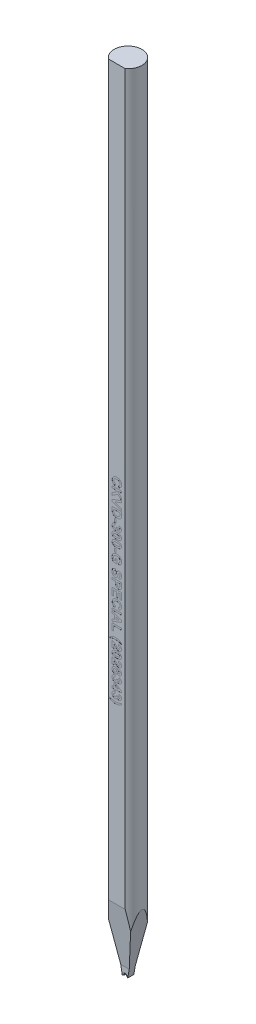
from build123d import *

# Parameters (mm, degrees)
SKETCH_TL_CUTTING_R       = 1.4986
TL_CUTTING_DEPTH          = 85.4964
SKETCH_TDF_GRINDING_W     = 3.0172
SKETCH_TDF_GRINDING_H     = 3.0172
TDF_GRINDING_DEPTH        = 86.522663762
SKETCH_ENGRAVING_W        = 0.166666667
SKETCH_ENGRAVING_H        = 0.371794872
SKETCH_ENGRAVING_W_2      = 1
SKETCH_ENGRAVING_H_2      = 0.192307693
ENGRAVING_DEPTH           = 0.005
VW_VR_GRINDING_DEPTH      = 1.5086
VW_VR_GRINDING_DEPTH_BACK = 1.5086
ISA_GRINDING_DEPTH        = 1.5086
ISA_GRINDING_DEPTH_BACK   = 1.5086
PRE_FRX_BRX_DEPTH         = 1.5086
PRE_FRX_BRX_DEPTH_BACK    = 1.5086
SKETCH_PRE_FRX_BRX_W      = 1.18348
SKETCH_PRE_FRX_BRX_H      = 0.89916
FR_EDM_R                  = 0.14986
BR_EDM_R                  = 0.14986
FA_BA_GRINDING_DEPTH      = 1.5086
FA_BA_GRINDING_DEPTH_BACK = 1.5086


with BuildPart() as part:
    # sketch_TL_cutting → TL_cutting (new body)
    with BuildSketch(Plane(origin=(0, 0, 0), x_dir=(1, 0, 0), z_dir=(0, 1, 0))):
        Circle(SKETCH_TL_CUTTING_R)
    extrude(amount=TL_CUTTING_DEPTH)

    # sketch_TDF_grinding → TDF_grinding (cut, through all)
    with BuildSketch(Plane(origin=(0, 0, 0), x_dir=(1, 0, 0), z_dir=(0, 1, 0))):
        with Locations((0, -2.71002)):
            Rectangle(SKETCH_TDF_GRINDING_W, SKETCH_TDF_GRINDING_H)
    extrude(amount=TDF_GRINDING_DEPTH, mode=Mode.SUBTRACT)

    # sketch_engraving → engraving (cut)
    # profile 1 of 26: a face of its own
    with BuildSketch(Plane.XY.offset(1.20142)):
        with BuildLine():
            Line((-0.128205128, 46.279430256), (-0.192307692, 46.087122564))
            add(Edge.make_bspline(
                [(-0.192307692, 46.087122564), (-0.204917923, 46.091029052), (-0.229612721, 46.098679184), (-0.2649877, 46.112757804), (-0.297871332, 46.128752008), (-0.328259475, 46.146579875), (-0.356049464, 46.166315258), (-0.381471598, 46.187809244), (-0.404368127, 46.211273424), (-0.424673345, 46.236690624), (-0.442633936, 46.263783711), (-0.457816548, 46.292876053), (-0.470893242, 46.32353117), (-0.481488041, 46.356060557), (-0.489972889, 46.390248151), (-0.495577171, 46.426254413), (-0.499377062, 46.463910896), (-0.499789062, 46.489623283), (-0.5, 46.502787628)],
                knots=[0, 0, 0, 0, 1.126670901, 2.206376047, 3.246533763, 4.245677351, 5.210506282, 6.152793389, 7.083980095, 8.004497442, 8.926231833, 9.854395169, 10.801995143, 11.768203916, 12.771938831, 13.805609698, 14.87650608, 16, 16, 16, 16], degree=3))
            add(Edge.make_bspline(
                [(-0.5, 46.502787628), (-0.499663994, 46.519036309), (-0.499003061, 46.550997949), (-0.492350465, 46.597739052), (-0.481969511, 46.642280328), (-0.467601869, 46.684689613), (-0.448555271, 46.724668786), (-0.42571373, 46.762593108), (-0.398318662, 46.798029391), (-0.367249987, 46.831170716), (-0.332452821, 46.861299196), (-0.294134751, 46.887292297), (-0.253074131, 46.909830491), (-0.208709772, 46.927756594), (-0.161353037, 46.941841791), (-0.110975156, 46.951688328), (-0.057578507, 46.957854942), (-0.020984357, 46.958557083), (-0.002203526, 46.958917436)],
                knots=[0, 0, 0, 0, 1.025134988, 2.016471176, 2.973446247, 3.909197306, 4.836872559, 5.763618465, 6.698581235, 7.658772073, 8.627106982, 9.597494692, 10.576422683, 11.578339294, 12.6118974, 13.690673505, 14.814808564, 16, 16, 16, 16], degree=3))
            add(Edge.make_bspline(
                [(-0.002203526, 46.958917436), (0.017576475, 46.9585492), (0.056163648, 46.957830839), (0.112313555, 46.951782878), (0.165084042, 46.941736768), (0.214577853, 46.928160058), (0.260470573, 46.909949249), (0.303160692, 46.888093909), (0.342311169, 46.861976152), (0.377833814, 46.832051091), (0.409480853, 46.798917852), (0.437377469, 46.763213428), (0.460593243, 46.724711041), (0.479896446, 46.683887336), (0.494630503, 46.640443397), (0.505304611, 46.594496602), (0.511505561, 46.546026054), (0.512376199, 46.51288808), (0.512820513, 46.495976731)],
                knots=[0, 0, 0, 0, 1.212773307, 2.365899439, 3.458117515, 4.504331001, 5.50806732, 6.480562534, 7.440239902, 8.387651817, 9.323121479, 10.245404239, 11.160468186, 12.07454208, 13.009500751, 13.96802424, 14.963018902, 16, 16, 16, 16], degree=3))
            add(Edge.make_bspline(
                [(0.512820513, 46.495976731), (0.512448361, 46.481207276), (0.511718707, 46.452249796), (0.506761415, 46.409844506), (0.498061698, 46.369656158), (0.486319015, 46.331467521), (0.470821797, 46.295495987), (0.451884357, 46.261677111), (0.429606892, 46.229894651), (0.412205553, 46.210745065), (0.403445513, 46.201104936)],
                knots=[0, 0, 0, 0, 1.098510076, 2.153775193, 3.169777012, 4.153122333, 5.120892526, 6.076995459, 7.031936742, 8, 8, 8, 8], degree=3))
            add(Edge.make_bspline(
                [(0.403445513, 46.201104936), (0.39787141, 46.195517644), (0.386592274, 46.184211818), (0.367549896, 46.169115368), (0.347050772, 46.154802058), (0.324745215, 46.141499068), (0.30046466, 46.129626849), (0.274581981, 46.118614097), (0.246997406, 46.108475069), (0.227800247, 46.102836604), (0.217948718, 46.099943077)],
                knots=[0, 0, 0, 0, 0.885292881, 1.791380647, 2.722937556, 3.69093542, 4.703306561, 5.754477758, 6.847650944, 8, 8, 8, 8], degree=3))
            Line((0.217948718, 46.099943077), (0.179487179, 46.292250769))
            add(Edge.make_bspline(
                [(0.179487179, 46.292250769), (0.1857949, 46.293885288), (0.198219456, 46.297104861), (0.21607256, 46.30361955), (0.233014714, 46.311091208), (0.248625569, 46.3203561), (0.263619506, 46.330182074), (0.277222328, 46.341844773), (0.290109132, 46.354349754), (0.301694454, 46.368238861), (0.312145605, 46.383113589), (0.321339918, 46.398823983), (0.329014435, 46.415408478), (0.335156827, 46.432741754), (0.340319842, 46.450765702), (0.34350638, 46.469652147), (0.345953545, 46.489235752), (0.3460861, 46.502578875), (0.346153846, 46.509398205)],
                knots=[0, 0, 0, 0, 1.051114734, 2.070420253, 3.064047898, 4.034553068, 4.997066449, 5.953344811, 6.921213386, 7.892675544, 8.867420182, 9.852654213, 10.826683617, 11.811917648, 12.818610352, 13.848120519, 14.900229319, 16, 16, 16, 16], degree=3))
            add(Edge.make_bspline(
                [(0.346153846, 46.509398205), (0.345958725, 46.518762256), (0.345576529, 46.53710423), (0.341532101, 46.56383448), (0.335695112, 46.589275692), (0.326982094, 46.61333706), (0.315677399, 46.635951698), (0.302244603, 46.657448905), (0.286035184, 46.677280806), (0.26758257, 46.695919764), (0.246135655, 46.712627721), (0.221779967, 46.727330652), (0.194212535, 46.739524121), (0.163711493, 46.749424409), (0.130202077, 46.757216736), (0.093641969, 46.762781162), (0.054005962, 46.765858434), (0.026581025, 46.766353903), (0.012419872, 46.766609744)],
                knots=[0, 0, 0, 0, 0.93816214, 1.837638998, 2.704791736, 3.551915875, 4.396257554, 5.235807848, 6.087970119, 6.959042444, 7.860386085, 8.80649345, 9.804409709, 10.875695391, 12.017327537, 13.250155505, 14.580089023, 16, 16, 16, 16], degree=3))
            add(Edge.make_bspline(
                [(0.012419872, 46.766609744), (-0.002609028, 46.766356423), (-0.031567402, 46.765868312), (-0.073337178, 46.762791685), (-0.111754322, 46.757191705), (-0.14688701, 46.749502849), (-0.178713725, 46.739552973), (-0.207179389, 46.727379106), (-0.23231734, 46.712906701), (-0.254110839, 46.696158275), (-0.272831387, 46.677557256), (-0.288926796, 46.657607439), (-0.302688307, 46.636426524), (-0.314010391, 46.613887053), (-0.322575422, 46.589903298), (-0.328786932, 46.564672371), (-0.332735688, 46.538101695), (-0.333131326, 46.519895799), (-0.333333333, 46.510600128)],
                knots=[0, 0, 0, 0, 1.475208372, 2.842499301, 4.107722225, 5.282836115, 6.369007568, 7.375918121, 8.315702116, 9.208439171, 10.065831443, 10.90006451, 11.71996243, 12.54067204, 13.369972975, 14.214060185, 15.088124569, 16, 16, 16, 16], degree=3))
            add(Edge.make_bspline(
                [(-0.333333333, 46.510600128), (-0.333161634, 46.503717953), (-0.332824013, 46.490185176), (-0.330681155, 46.470182689), (-0.326591822, 46.45098438), (-0.321184418, 46.432496281), (-0.314399721, 46.414646559), (-0.305696319, 46.39770748), (-0.295693052, 46.381345777), (-0.283969989, 46.36590094), (-0.270808612, 46.351166156), (-0.255597341, 46.337727159), (-0.238701667, 46.325261373), (-0.220008678, 46.313926947), (-0.199678377, 46.30334516), (-0.177394008, 46.294342121), (-0.153515697, 46.285954984), (-0.136789345, 46.281643153), (-0.128205128, 46.279430256)],
                knots=[0, 0, 0, 0, 0.980177776, 1.927374078, 2.859849964, 3.771585772, 4.668674471, 5.574490016, 6.479656464, 7.396337719, 8.332153134, 9.288470092, 10.28125149, 11.318486971, 12.398724812, 13.541284404, 14.738150009, 16, 16, 16, 16], degree=3))
        make_face()
    # profile 2 of 26: a face of its own
    with BuildSketch(Plane.XY.offset(1.20142)):
        Polygon((-0.5, 45.920455897), (0.5, 45.920455897), (0.5, 45.728148205), (0.052283654, 45.728148205), (0.5, 45.306473526), (0.5, 45.042250769), (0.11338141, 45.422058462), (-0.5, 45.029430256), (-0.5, 45.285640192), (-0.035456731, 45.567891795), (-0.198517628, 45.728148205), (-0.5, 45.728148205), align=None)
    # profile 3 of 26: a face of its own
    with BuildSketch(Plane.XY.offset(1.20142)):
        Polygon((-0.5, 44.653228333), (0.5, 45.02302), (0.5, 44.819895), (-0.243589744, 44.555071282), (0.5, 44.291249167), (0.5, 44.087122564), (-0.5, 44.455511987), align=None)
    # profile 4 of 26: a face of its own
    with BuildSketch(Plane.XY.offset(1.20142)):
        with BuildLine():
            Line((0.5, 43.997378974), (0.5, 43.630592115))
            add(Edge.make_bspline(
                [(0.5, 43.630592115), (0.500005193, 43.620574571), (0.500015306, 43.601068084), (0.498840892, 43.572759066), (0.497659587, 43.546286494), (0.495294873, 43.521726352), (0.492816233, 43.498993432), (0.489678088, 43.478046942), (0.485656212, 43.459019202), (0.482484481, 43.447020319), (0.480969551, 43.441289231)],
                knots=[0, 0, 0, 0, 1.259756885, 2.453039283, 3.563158368, 4.591894114, 5.55549294, 6.43918076, 7.254497783, 8, 8, 8, 8], degree=3))
            add(Edge.make_bspline(
                [(0.480969551, 43.441289231), (0.478637325, 43.434120254), (0.474014881, 43.419911431), (0.465827813, 43.399058378), (0.455960096, 43.379224479), (0.445111978, 43.359949819), (0.432903728, 43.341677553), (0.419595761, 43.323962873), (0.404753223, 43.307329803), (0.383633179, 43.28579514), (0.35420815, 43.261370255), (0.315375005, 43.23553972), (0.272594656, 43.213802014), (0.234409605, 43.198610641), (0.20183843, 43.188566542), (0.175754603, 43.181998141), (0.148301213, 43.176326468), (0.119383738, 43.172076292), (0.08913491, 43.168414906), (0.057465542, 43.165787238), (0.024383276, 43.16448625), (0.001870575, 43.164194494), (-0.009615385, 43.164045641)],
                knots=[0, 0, 0, 0, 0.745431882, 1.477436776, 2.212739876, 2.934276521, 3.663147754, 4.384200836, 5.123377481, 5.865761747, 7.365547505, 8.894711587, 10.468722596, 12.101948761, 12.951987285, 13.837595333, 14.760899389, 15.722756883, 16.726861385, 17.773652936, 18.864119771, 20, 20, 20, 20], degree=3))
            add(Edge.make_bspline(
                [(-0.009615385, 43.164045641), (-0.0294616, 43.164437046), (-0.067834928, 43.16519384), (-0.123301552, 43.170791211), (-0.17465514, 43.180086648), (-0.206804138, 43.189797075), (-0.222355769, 43.194494359)],
                knots=[0, 0, 0, 0, 1.103491527, 2.133638164, 3.0971734, 4, 4, 4, 4], degree=3))
            add(Edge.make_bspline(
                [(-0.222355769, 43.194494359), (-0.231274521, 43.197668003), (-0.248819098, 43.203911057), (-0.274127236, 43.214835932), (-0.298211673, 43.226640337), (-0.321053432, 43.239422184), (-0.342549771, 43.253246052), (-0.362636394, 43.268163645), (-0.381577746, 43.283943731), (-0.393236239, 43.29537549), (-0.399038462, 43.301064872)],
                knots=[0, 0, 0, 0, 1.090884612, 2.145940218, 3.175104604, 4.181306866, 5.161203701, 6.118658341, 7.063689906, 8, 8, 8, 8], degree=3))
            add(Edge.make_bspline(
                [(-0.399038462, 43.301064872), (-0.407300305, 43.310351145), (-0.424264154, 43.329418431), (-0.445652736, 43.36276995), (-0.464086504, 43.400645276), (-0.473760833, 43.427959168), (-0.478766026, 43.442090513)],
                knots=[0, 0, 0, 0, 0.912008655, 1.872605891, 2.89935344, 4, 4, 4, 4], degree=3))
            add(Edge.make_bspline(
                [(-0.478766026, 43.442090513), (-0.4805228, 43.447810486), (-0.484168894, 43.459681996), (-0.488062998, 43.478505444), (-0.492165475, 43.498599947), (-0.49463687, 43.520197223), (-0.497243066, 43.543073081), (-0.498706299, 43.567409822), (-0.49974511, 43.593123081), (-0.499913777, 43.610759175), (-0.5, 43.619774808)],
                knots=[0, 0, 0, 0, 0.799129865, 1.658552685, 2.566799617, 3.538529252, 4.561352959, 5.643373779, 6.795284424, 8, 8, 8, 8], degree=3))
            Line((-0.5, 43.619774808), (-0.5, 43.997378974))
            Line((-0.5, 43.997378974), (0.5, 43.997378974))
        make_face()
        with BuildLine():
            Line((0.333333333, 43.805071282), (-0.333333333, 43.805071282))
            Line((-0.333333333, 43.805071282), (-0.333333333, 43.646818077))
            add(Edge.make_bspline(
                [(-0.333333333, 43.646818077), (-0.333276671, 43.63967336), (-0.333167574, 43.625917049), (-0.332847006, 43.606011316), (-0.331979167, 43.587718115), (-0.331080228, 43.570941614), (-0.329595022, 43.55572549), (-0.328134266, 43.542003535), (-0.326090699, 43.529852132), (-0.324477534, 43.522347127), (-0.323717949, 43.518813269)],
                knots=[0, 0, 0, 0, 1.333384787, 2.567275092, 3.714769766, 4.750907381, 5.701951617, 6.567520054, 7.325492842, 8, 8, 8, 8], degree=3))
            add(Edge.make_bspline(
                [(-0.323717949, 43.518813269), (-0.321509316, 43.510536575), (-0.317207482, 43.494415757), (-0.307617456, 43.471780499), (-0.296048139, 43.451298507), (-0.282136533, 43.43262677), (-0.26455548, 43.41579967), (-0.242070693, 43.401435683), (-0.215254411, 43.388142192), (-0.189584523, 43.379038806), (-0.16665678, 43.372504413), (-0.147412959, 43.368081165), (-0.126593091, 43.364585591), (-0.104279343, 43.361578942), (-0.080500412, 43.359149499), (-0.055170426, 43.357637784), (-0.028320392, 43.356606029), (-0.009883527, 43.356439161), (-0.000400641, 43.356353333)],
                knots=[0, 0, 0, 0, 1.038686998, 2.023088296, 2.974059649, 3.888265163, 4.839857954, 5.909819677, 7.113156087, 8.466843969, 9.20827164, 10.006482943, 10.861893492, 11.769681931, 12.739021491, 13.762258324, 14.849031541, 16, 16, 16, 16], degree=3))
            add(Edge.make_bspline(
                [(-0.000400641, 43.356353333), (0.009082275, 43.3564385), (0.027452469, 43.356603485), (0.054102292, 43.357633664), (0.079033415, 43.359136863), (0.102276578, 43.361583691), (0.123864169, 43.364543456), (0.143813574, 43.368080891), (0.161996804, 43.372474423), (0.183589283, 43.379027511), (0.207947697, 43.388864996), (0.23429421, 43.402691199), (0.2571147, 43.418956402), (0.276689574, 43.437311558), (0.29287817, 43.458398569), (0.306422028, 43.481769371), (0.316938162, 43.507900279), (0.321416742, 43.526489318), (0.323717949, 43.536040833)],
                knots=[0, 0, 0, 0, 1.118059345, 2.165891593, 3.144157881, 4.062285166, 4.920717571, 5.712910489, 6.449981617, 7.12489426, 8.371943983, 9.541298068, 10.624898781, 11.666293176, 12.69306237, 13.747704633, 14.842713931, 16, 16, 16, 16], degree=3))
            add(Edge.make_bspline(
                [(0.323717949, 43.536040833), (0.324486218, 43.540175143), (0.326177652, 43.549277311), (0.328151987, 43.564381571), (0.329628909, 43.582168179), (0.331099472, 43.602597116), (0.331977905, 43.625647064), (0.332859431, 43.651352571), (0.333166326, 43.679736851), (0.333276065, 43.699569207), (0.333333333, 43.709919038)],
                knots=[0, 0, 0, 0, 0.578739524, 1.274162912, 2.095457587, 3.035141998, 4.093102578, 5.270121571, 6.575369351, 8, 8, 8, 8], degree=3))
            Line((0.333333333, 43.709919038), (0.333333333, 43.805071282))
        make_face(mode=Mode.SUBTRACT)
    # profile 5 of 26: a face of its own
    with BuildSketch(Plane.XY.offset(1.20142)):
        with Locations((-0.147435898, 42.837122564)):
            Rectangle(SKETCH_ENGRAVING_W, SKETCH_ENGRAVING_H)
    # profile 6 of 26: a face of its own
    with BuildSketch(Plane.XY.offset(1.20142)):
        with BuildLine():
            Line((-0.215945513, 42.587122564), (-0.192307692, 42.394814872))
            add(Edge.make_bspline(
                [(-0.192307692, 42.394814872), (-0.204132194, 42.393154047), (-0.226576764, 42.390001568), (-0.25764429, 42.380172911), (-0.284674848, 42.367339233), (-0.306838708, 42.350357778), (-0.324372016, 42.33073589), (-0.33711688, 42.30891994), (-0.34490548, 42.284887347), (-0.345732378, 42.268136439), (-0.346153846, 42.259598526)],
                knots=[0, 0, 0, 0, 1.266221457, 2.403466716, 3.446976871, 4.428566981, 5.347951143, 6.225000641, 7.095285456, 8, 8, 8, 8], degree=3))
            add(Edge.make_bspline(
                [(-0.346153846, 42.259598526), (-0.346055611, 42.254983461), (-0.345861023, 42.245841738), (-0.343788926, 42.232409506), (-0.340465357, 42.219538943), (-0.335437029, 42.207351108), (-0.329556159, 42.195606661), (-0.32227181, 42.184356899), (-0.313281658, 42.174042443), (-0.303428531, 42.163979798), (-0.292217285, 42.155048114), (-0.280052259, 42.147180902), (-0.267055651, 42.140274907), (-0.252891939, 42.134922089), (-0.237868043, 42.130732024), (-0.221918716, 42.127736531), (-0.205104086, 42.125913476), (-0.193581061, 42.125695398), (-0.187700321, 42.125584103)],
                knots=[0, 0, 0, 0, 0.951793398, 1.885354025, 2.797928458, 3.688489604, 4.600647717, 5.506538063, 6.445271935, 7.419741996, 8.409776722, 9.395967385, 10.406883209, 11.440832221, 12.514165763, 13.622322902, 14.786559767, 16, 16, 16, 16], degree=3))
            add(Edge.make_bspline(
                [(-0.187700321, 42.125584103), (-0.176786947, 42.126002422), (-0.155968497, 42.126800413), (-0.126418152, 42.132926809), (-0.100528778, 42.143633017), (-0.078485293, 42.158311647), (-0.060832569, 42.176100913), (-0.047691388, 42.196110944), (-0.040013472, 42.218334606), (-0.038982665, 42.233767528), (-0.038461538, 42.241569679)],
                knots=[0, 0, 0, 0, 1.241181749, 2.367689556, 3.413199457, 4.409869786, 5.360751057, 6.245864667, 7.113192516, 8, 8, 8, 8], degree=3))
            add(Edge.make_bspline(
                [(-0.038461538, 42.241569679), (-0.038603641, 42.247123112), (-0.038904883, 42.258895803), (-0.04203482, 42.277207586), (-0.046354275, 42.297176665), (-0.050509304, 42.31077409), (-0.052684295, 42.317891795)],
                knots=[0, 0, 0, 0, 0.854525515, 1.811503923, 2.854410343, 4, 4, 4, 4], degree=3))
            Line((-0.052684295, 42.317891795), (0.102564103, 42.299862949))
            add(Edge.make_bspline(
                [(0.102564103, 42.299862949), (0.102472429, 42.294518846), (0.102294537, 42.284148639), (0.103550083, 42.269005032), (0.10584242, 42.25483013), (0.10956176, 42.241657094), (0.114073964, 42.229473353), (0.119743619, 42.21817343), (0.126797738, 42.208029885), (0.137452935, 42.195694156), (0.153346669, 42.182992172), (0.175381237, 42.171939273), (0.200195104, 42.165183806), (0.217704887, 42.164433684), (0.226762821, 42.164045641)],
                knots=[0, 0, 0, 0, 0.916921599, 1.779281976, 2.604591006, 3.377627834, 4.124827521, 4.832199257, 5.541147775, 6.239830602, 7.625300353, 8.999010263, 10.447566839, 12, 12, 12, 12], degree=3))
            add(Edge.make_bspline(
                [(0.226762821, 42.164045641), (0.234476764, 42.164296334), (0.249283176, 42.164777523), (0.270180788, 42.170015916), (0.288882255, 42.177890608), (0.304586758, 42.189518575), (0.317487731, 42.203674609), (0.326781862, 42.220314939), (0.332438867, 42.239208834), (0.333026806, 42.252479453), (0.333333333, 42.259398205)],
                knots=[0, 0, 0, 0, 1.147344735, 2.202253707, 3.191599761, 4.153119954, 5.090433954, 6.026214277, 6.97094964, 8, 8, 8, 8], degree=3))
            add(Edge.make_bspline(
                [(0.333333333, 42.259398205), (0.332987648, 42.266328214), (0.332308151, 42.279950209), (0.325708071, 42.299418134), (0.315274673, 42.317261507), (0.300599014, 42.333130612), (0.282168696, 42.346829405), (0.259890756, 42.357786627), (0.233746812, 42.365218565), (0.214986903, 42.367811309), (0.205128205, 42.369173846)],
                knots=[0, 0, 0, 0, 0.89036141, 1.750142028, 2.61780756, 3.537452052, 4.514848764, 5.561443886, 6.71849122, 8, 8, 8, 8], degree=3))
            Line((0.205128205, 42.369173846), (0.233974359, 42.561481538))
            add(Edge.make_bspline(
                [(0.233974359, 42.561481538), (0.248657574, 42.558312323), (0.276764536, 42.552245734), (0.316129698, 42.539821503), (0.350961973, 42.525331687), (0.381387831, 42.508061655), (0.408215463, 42.487955814), (0.431647434, 42.46423335), (0.452006068, 42.43690244), (0.469141566, 42.406227941), (0.48286138, 42.372858807), (0.493019554, 42.337350657), (0.49884023, 42.299788376), (0.49960808, 42.274108246), (0.5, 42.261000769)],
                knots=[0, 0, 0, 0, 1.22092895, 2.337131514, 3.351677773, 4.283094182, 5.174661873, 6.069250129, 6.984703325, 7.937694494, 8.918809374, 9.912257166, 10.934388599, 12, 12, 12, 12], degree=3))
            add(Edge.make_bspline(
                [(0.5, 42.261000769), (0.499743324, 42.2498356), (0.499240363, 42.227957211), (0.494922998, 42.195962302), (0.487994845, 42.165606892), (0.478138042, 42.136992682), (0.465473847, 42.110050657), (0.449646388, 42.085027035), (0.431514029, 42.06128228), (0.417247021, 42.047296666), (0.41005609, 42.040247564)],
                knots=[0, 0, 0, 0, 1.090586174, 2.137027055, 3.148380755, 4.128502444, 5.088724121, 6.050075692, 7.017189, 8, 8, 8, 8], degree=3))
            add(Edge.make_bspline(
                [(0.41005609, 42.040247564), (0.403937931, 42.034794347), (0.391853934, 42.024023677), (0.372464834, 42.010072563), (0.352400741, 41.998285213), (0.33177098, 41.988731955), (0.310637907, 41.980971566), (0.288816497, 41.975564728), (0.26639464, 41.972269626), (0.251213033, 41.971915679), (0.243589744, 41.971737949)],
                knots=[0, 0, 0, 0, 1.065686435, 2.104841259, 3.101590809, 4.088754543, 5.058798532, 6.025881737, 7.008716709, 8, 8, 8, 8], degree=3))
            add(Edge.make_bspline(
                [(0.243589744, 41.971737949), (0.232867144, 41.972128156), (0.211730927, 41.972897325), (0.180999661, 41.98000324), (0.151856431, 41.9913229), (0.124562561, 42.007377174), (0.09868881, 42.027610588), (0.075169415, 42.052936452), (0.052695262, 42.082182269), (0.04001359, 42.104185891), (0.033453526, 42.115568077)],
                knots=[0, 0, 0, 0, 0.957658001, 1.887720032, 2.804751961, 3.743912922, 4.709136476, 5.731252806, 6.826406682, 8, 8, 8, 8], degree=3))
            add(Edge.make_bspline(
                [(0.033453526, 42.115568077), (0.031822372, 42.108795609), (0.028603533, 42.095431152), (0.022022537, 42.076134744), (0.01367829, 42.058077672), (0.004232675, 42.040895623), (-0.006542103, 42.024685765), (-0.018789165, 42.009493779), (-0.032819972, 41.995776037), (-0.047679673, 41.982672996), (-0.063887586, 41.971123284), (-0.081022983, 41.961091663), (-0.098866636, 41.952406197), (-0.117582182, 41.945394095), (-0.137087229, 41.939953972), (-0.157475267, 41.936226248), (-0.178623511, 41.933713745), (-0.193034825, 41.933423264), (-0.200320513, 41.93327641)],
                knots=[0, 0, 0, 0, 1.03751577, 2.047382676, 3.031239205, 3.997486026, 4.965932412, 5.927662117, 6.898405035, 7.88572577, 8.876798211, 9.857834218, 10.841137353, 11.829660183, 12.831310853, 13.853692922, 14.91492721, 16, 16, 16, 16], degree=3))
            add(Edge.make_bspline(
                [(-0.200320513, 41.93327641), (-0.2109584, 41.933492661), (-0.231937745, 41.933919137), (-0.2626715, 41.938894881), (-0.292387684, 41.945847328), (-0.320688592, 41.956505264), (-0.348018602, 41.969664593), (-0.373770643, 41.986332865), (-0.398719241, 42.005395045), (-0.421838487, 42.027571285), (-0.443209677, 42.05170231), (-0.461662849, 42.077803574), (-0.477734226, 42.105082651), (-0.490419897, 42.134067217), (-0.500667813, 42.164321873), (-0.507459472, 42.196196996), (-0.512114414, 42.229413455), (-0.512582989, 42.252103302), (-0.512820513, 42.263604936)],
                knots=[0, 0, 0, 0, 1.00633359, 1.984625146, 2.941575753, 3.891818189, 4.841976474, 5.80848851, 6.791183869, 7.810935832, 8.837000052, 9.838854168, 10.83333837, 11.829730352, 12.829487178, 13.852742075, 14.911540725, 16, 16, 16, 16], degree=3))
            add(Edge.make_bspline(
                [(-0.512820513, 42.263604936), (-0.512637793, 42.274503744), (-0.51227889, 42.29591157), (-0.508027091, 42.327250842), (-0.501772194, 42.357266869), (-0.492621954, 42.38578445), (-0.481351422, 42.413051997), (-0.466822586, 42.438554845), (-0.450309361, 42.462949476), (-0.430965435, 42.485438893), (-0.409882535, 42.506349186), (-0.386697234, 42.524716375), (-0.362149526, 42.541083988), (-0.336021778, 42.555161702), (-0.308246096, 42.566831545), (-0.278894175, 42.575918132), (-0.248055897, 42.58316486), (-0.226796469, 42.58578515), (-0.215945513, 42.587122564)],
                knots=[0, 0, 0, 0, 1.077528213, 2.11651914, 3.123276654, 4.10732375, 5.075386463, 6.036572488, 7.005896639, 7.98540975, 8.966414275, 9.939311093, 10.906719916, 11.882103104, 12.870994428, 13.882228509, 14.919075059, 16, 16, 16, 16], degree=3))
        make_face()
    # profile 7 of 26: a face of its own
    with BuildSketch(Plane.XY.offset(1.20142)):
        with BuildLine():
            add(Edge.make_bspline(
                [(0.5, 41.490968718), (0.49971384, 41.479064998), (0.499156721, 41.455889821), (0.494192381, 41.422127508), (0.486315205, 41.390374925), (0.474936732, 41.360625943), (0.460535804, 41.332729267), (0.442472771, 41.307077415), (0.421624591, 41.28307643), (0.405435577, 41.269220797), (0.397235577, 41.262202692)],
                knots=[0, 0, 0, 0, 1.098626248, 2.138899374, 3.143835643, 4.113754749, 5.073488057, 6.034745239, 7.004566348, 8, 8, 8, 8], degree=3))
            add(Edge.make_bspline(
                [(0.397235577, 41.262202692), (0.392013767, 41.258187993), (0.381356969, 41.249994695), (0.364136726, 41.23896029), (0.345869985, 41.228351685), (0.326116385, 41.219093442), (0.305221356, 41.210220078), (0.283126793, 41.202029313), (0.259707844, 41.19479695), (0.235071142, 41.188492124), (0.209179241, 41.182598627), (0.181968999, 41.177661398), (0.15350924, 41.173435972), (0.123831018, 41.170140738), (0.092992495, 41.167186339), (0.060842825, 41.165569757), (0.027454838, 41.164245267), (0.004742429, 41.164112949), (-0.006810897, 41.164045641)],
                knots=[0, 0, 0, 0, 0.746775751, 1.524038446, 2.317840886, 3.141016509, 3.996283186, 4.892488336, 5.812382473, 6.774967264, 7.776368117, 8.823659909, 9.910833035, 11.039122168, 12.210293276, 13.424012874, 14.68964937, 16, 16, 16, 16], degree=3))
            add(Edge.make_bspline(
                [(-0.006810897, 41.164045641), (-0.01836425, 41.164111934), (-0.041009977, 41.164241876), (-0.074330982, 41.165574693), (-0.106413621, 41.167187781), (-0.13725379, 41.170133853), (-0.166926114, 41.173460728), (-0.195353975, 41.177566272), (-0.22243919, 41.182884764), (-0.248289812, 41.188691418), (-0.27303117, 41.194956077), (-0.296407841, 41.2025099), (-0.318777777, 41.210370303), (-0.339699687, 41.219449898), (-0.359477735, 41.229040372), (-0.377930928, 41.239491112), (-0.395257891, 41.250648726), (-0.40597091, 41.258921289), (-0.411258013, 41.263003974)],
                knots=[0, 0, 0, 0, 1.308411734, 2.564617834, 3.776541518, 4.94597967, 6.0725993, 7.15816376, 8.197872509, 9.197791611, 10.158952087, 11.086962723, 11.979249638, 12.843171697, 13.668427753, 14.467630577, 15.243743175, 16, 16, 16, 16], degree=3))
            add(Edge.make_bspline(
                [(-0.411258013, 41.263003974), (-0.419387722, 41.269957875), (-0.435436162, 41.283685209), (-0.456111536, 41.307420465), (-0.473801555, 41.3330309), (-0.487914093, 41.360877064), (-0.499368982, 41.390481236), (-0.506993451, 41.422285546), (-0.511967929, 41.455955616), (-0.512532265, 41.479131213), (-0.512820513, 41.490968718)],
                knots=[0, 0, 0, 0, 0.991667276, 1.957599061, 2.911530233, 3.873218945, 4.847995157, 5.850445929, 6.902062539, 8, 8, 8, 8], degree=3))
            add(Edge.make_bspline(
                [(-0.512820513, 41.490968718), (-0.512476011, 41.502941133), (-0.511800941, 41.526401702), (-0.506449472, 41.560655149), (-0.497876451, 41.593214622), (-0.485636462, 41.623963234), (-0.469774335, 41.652856989), (-0.45076002, 41.680121616), (-0.427732542, 41.705163948), (-0.40629523, 41.724769361), (-0.386925042, 41.739112741), (-0.37086259, 41.749229036), (-0.353675124, 41.759005358), (-0.33482528, 41.767443499), (-0.314870578, 41.775768475), (-0.293380967, 41.783141787), (-0.270541238, 41.789646959), (-0.246455682, 41.795754901), (-0.220958398, 41.800848025), (-0.194124629, 41.805532952), (-0.165840258, 41.809224927), (-0.136262825, 41.812498243), (-0.105322509, 41.814802844), (-0.073069943, 41.816674475), (-0.039401887, 41.817612969), (-0.01649349, 41.817797608), (-0.004807692, 41.817891795)],
                knots=[0, 0, 0, 0, 1.257818097, 2.464759732, 3.634271214, 4.790227596, 5.933394726, 7.09190477, 8.274482889, 9.50191983, 10.139172818, 10.805000628, 11.49619854, 12.215266328, 12.973768034, 13.768328009, 14.601232062, 15.469317089, 16.379095881, 17.333267023, 18.331755967, 19.376479622, 20.460535752, 21.592206075, 22.771760786, 24, 24, 24, 24], degree=3))
            add(Edge.make_bspline(
                [(-0.004807692, 41.817891795), (0.006678925, 41.817826), (0.02919122, 41.817697052), (0.062378132, 41.816354948), (0.094328674, 41.814761634), (0.12509981, 41.81178902), (0.154640959, 41.808489515), (0.183004063, 41.804376894), (0.209982531, 41.798958814), (0.235876189, 41.793609743), (0.260431507, 41.786869782), (0.2837906, 41.779444475), (0.306110518, 41.771610136), (0.326924245, 41.762437854), (0.346659803, 41.752902898), (0.365109758, 41.742444838), (0.382437536, 41.731289066), (0.39315045, 41.723016265), (0.3984375, 41.718933462)],
                knots=[0, 0, 0, 0, 1.304443357, 2.556541329, 3.771813033, 4.936929721, 6.066661712, 7.147723817, 8.190304831, 9.191350322, 10.149780912, 11.080355239, 11.975107155, 12.834450748, 13.66198663, 14.463397305, 15.241653965, 16, 16, 16, 16], degree=3))
            add(Edge.make_bspline(
                [(0.3984375, 41.718933462), (0.406566428, 41.711979179), (0.422613323, 41.698251089), (0.443299998, 41.674521361), (0.460913987, 41.648939209), (0.475197493, 41.621174301), (0.486497465, 41.591502107), (0.494183265, 41.559656121), (0.499144648, 41.525980686), (0.499710816, 41.502805839), (0.5, 41.490968718)],
                knots=[0, 0, 0, 0, 0.991631672, 1.957528776, 2.911425699, 3.867574088, 4.848108326, 5.850523106, 6.902101959, 8, 8, 8, 8], degree=3))
        make_face()
        with BuildLine():
            add(Edge.make_bspline(
                [(0.333333333, 41.490968718), (0.333068079, 41.497136684), (0.332548986, 41.509207158), (0.328316127, 41.526762094), (0.321759633, 41.543343165), (0.312130705, 41.558901206), (0.299093083, 41.57330978), (0.281476094, 41.585517658), (0.259881539, 41.596071162), (0.243736, 41.601350771), (0.235176282, 41.604149808)],
                knots=[0, 0, 0, 0, 0.909107913, 1.77908945, 2.650019014, 3.530482969, 4.465025013, 5.495890128, 6.672421267, 8, 8, 8, 8], degree=3))
            add(Edge.make_bspline(
                [(0.235176282, 41.604149808), (0.228718042, 41.605897997), (0.214837576, 41.609655317), (0.192206647, 41.61391972), (0.166522939, 41.617436485), (0.137792419, 41.620406038), (0.105999886, 41.622822628), (0.071125109, 41.624310848), (0.033192525, 41.625339478), (0.006878451, 41.625500391), (-0.006810897, 41.625584103)],
                knots=[0, 0, 0, 0, 0.658986521, 1.416336438, 2.266694271, 3.212608458, 4.261595115, 5.407496572, 6.651304179, 8, 8, 8, 8], degree=3))
            add(Edge.make_bspline(
                [(-0.006810897, 41.625584103), (-0.020433943, 41.625593117), (-0.046549094, 41.625610397), (-0.084006477, 41.624436163), (-0.118154033, 41.62326872), (-0.148991056, 41.620899061), (-0.176626244, 41.618560892), (-0.200847568, 41.615023343), (-0.221857789, 41.611470608), (-0.244486895, 41.605437153), (-0.268257705, 41.597121394), (-0.292448985, 41.585892977), (-0.311537375, 41.573227058), (-0.325415776, 41.558695587), (-0.334597404, 41.542950329), (-0.341538269, 41.526646395), (-0.345246665, 41.509094555), (-0.345848983, 41.497060013), (-0.346153846, 41.490968718)],
                knots=[0, 0, 0, 0, 1.613038927, 3.092168624, 4.43749063, 5.658264602, 6.75425577, 7.720394221, 8.556328411, 9.275513998, 10.490872946, 11.534172084, 12.42681833, 13.187531851, 13.88996177, 14.574222125, 15.278341114, 16, 16, 16, 16], degree=3))
            add(Edge.make_bspline(
                [(-0.346153846, 41.490968718), (-0.345874419, 41.48487088), (-0.345321688, 41.472808799), (-0.341225408, 41.455276833), (-0.334465655, 41.438719336), (-0.325029126, 41.423056493), (-0.311901617, 41.40863441), (-0.294300445, 41.396417614), (-0.272700888, 41.38586693), (-0.25655611, 41.380586893), (-0.247996795, 41.377787628)],
                knots=[0, 0, 0, 0, 0.899391665, 1.779078861, 2.640979247, 3.529945348, 4.464599804, 5.495588918, 6.672261578, 8, 8, 8, 8], degree=3))
            add(Edge.make_bspline(
                [(-0.247996795, 41.377787628), (-0.241538043, 41.376041968), (-0.227719754, 41.372307186), (-0.205229709, 41.368012396), (-0.179679092, 41.36448611), (-0.151079269, 41.361544791), (-0.11935541, 41.359104431), (-0.084546407, 41.357628845), (-0.046680798, 41.356599247), (-0.020433482, 41.356437356), (-0.006810897, 41.356353333)],
                knots=[0, 0, 0, 0, 0.66114423, 1.414496391, 2.261103113, 3.210114492, 4.255954433, 5.405607896, 6.653488082, 8, 8, 8, 8], degree=3))
            add(Edge.make_bspline(
                [(-0.006810897, 41.356353333), (0.006810741, 41.356467109), (0.032921137, 41.356685199), (0.070464093, 41.357312091), (0.104645163, 41.359067006), (0.13553417, 41.360823226), (0.163028833, 41.363788631), (0.187277888, 41.366731537), (0.208178651, 41.370803667), (0.23096624, 41.376395697), (0.254848985, 41.38473368), (0.278913284, 41.39630584), (0.298191428, 41.40874291), (0.312146257, 41.423249879), (0.321683592, 41.438968044), (0.328364426, 41.455420374), (0.332523972, 41.472869531), (0.333060584, 41.48486941), (0.333333333, 41.490968718)],
                knots=[0, 0, 0, 0, 1.611458614, 3.088895909, 4.441089836, 5.660086535, 6.747875232, 7.711965119, 8.548505902, 9.26500436, 10.486583113, 11.532259092, 12.419544583, 13.184925779, 13.890764661, 14.581638641, 15.279074115, 16, 16, 16, 16], degree=3))
        make_face(mode=Mode.SUBTRACT)
    # profile 8 of 26: a face of its own
    with BuildSketch(Plane.XY.offset(1.20142)):
        with BuildLine():
            add(Edge.make_bspline(
                [(0.5, 40.721737949), (0.49971384, 40.709834229), (0.499156721, 40.686659051), (0.494192381, 40.652896739), (0.486315205, 40.621144156), (0.474936732, 40.591395173), (0.460535804, 40.563498497), (0.442472771, 40.537846646), (0.421624591, 40.513845661), (0.405435577, 40.499990028), (0.397235577, 40.492971923)],
                knots=[0, 0, 0, 0, 1.098626248, 2.138899374, 3.143835643, 4.113754749, 5.073488057, 6.034745239, 7.004566348, 8, 8, 8, 8], degree=3))
            add(Edge.make_bspline(
                [(0.397235577, 40.492971923), (0.392013767, 40.488957224), (0.381356969, 40.480763926), (0.364136726, 40.46972952), (0.345869985, 40.459120915), (0.326116385, 40.449862673), (0.305221356, 40.440989309), (0.283126793, 40.432798544), (0.259707844, 40.42556618), (0.235071142, 40.419261354), (0.209179241, 40.413367858), (0.181968999, 40.408430628), (0.15350924, 40.404205203), (0.123831018, 40.400909969), (0.092992495, 40.39795557), (0.060842825, 40.396338988), (0.027454838, 40.395014498), (0.004742429, 40.394882179), (-0.006810897, 40.394814872)],
                knots=[0, 0, 0, 0, 0.746775751, 1.524038446, 2.317840886, 3.141016509, 3.996283186, 4.892488336, 5.812382473, 6.774967264, 7.776368117, 8.823659909, 9.910833035, 11.039122168, 12.210293276, 13.424012874, 14.68964937, 16, 16, 16, 16], degree=3))
            add(Edge.make_bspline(
                [(-0.006810897, 40.394814872), (-0.01836425, 40.394881165), (-0.041009977, 40.395011107), (-0.074330982, 40.396343924), (-0.106413621, 40.397957012), (-0.13725379, 40.400903084), (-0.166926114, 40.404229959), (-0.195353975, 40.408335503), (-0.22243919, 40.413653995), (-0.248289812, 40.419460649), (-0.27303117, 40.425725308), (-0.296407841, 40.433279131), (-0.318777777, 40.441139533), (-0.339699687, 40.450219129), (-0.359477735, 40.459809602), (-0.377930928, 40.470260342), (-0.395257891, 40.481417957), (-0.40597091, 40.48969052), (-0.411258013, 40.493773205)],
                knots=[0, 0, 0, 0, 1.308411734, 2.564617834, 3.776541518, 4.94597967, 6.0725993, 7.15816376, 8.197872509, 9.197791611, 10.158952087, 11.086962723, 11.979249638, 12.843171697, 13.668427753, 14.467630577, 15.243743175, 16, 16, 16, 16], degree=3))
            add(Edge.make_bspline(
                [(-0.411258013, 40.493773205), (-0.419387722, 40.500727105), (-0.435436162, 40.51445444), (-0.456111536, 40.538189695), (-0.473801555, 40.563800131), (-0.487914093, 40.591646295), (-0.499368982, 40.621250467), (-0.506993451, 40.653054777), (-0.511967929, 40.686724847), (-0.512532265, 40.709900444), (-0.512820513, 40.721737949)],
                knots=[0, 0, 0, 0, 0.991667276, 1.957599061, 2.911530233, 3.873218945, 4.847995157, 5.850445929, 6.902062539, 8, 8, 8, 8], degree=3))
            add(Edge.make_bspline(
                [(-0.512820513, 40.721737949), (-0.512476011, 40.733710364), (-0.511800941, 40.757170933), (-0.506449472, 40.791424379), (-0.497876451, 40.823983853), (-0.485636462, 40.854732465), (-0.469774335, 40.88362622), (-0.45076002, 40.910890847), (-0.427732542, 40.935933179), (-0.40629523, 40.955538592), (-0.386925042, 40.969881971), (-0.37086259, 40.979998267), (-0.353675124, 40.989774589), (-0.33482528, 40.99821273), (-0.314870578, 41.006537706), (-0.293380967, 41.013911018), (-0.270541238, 41.02041619), (-0.246455682, 41.026524132), (-0.220958398, 41.031617256), (-0.194124629, 41.036302183), (-0.165840258, 41.039994157), (-0.136262825, 41.043267473), (-0.105322509, 41.045572075), (-0.073069943, 41.047443706), (-0.039401887, 41.0483822), (-0.01649349, 41.048566839), (-0.004807692, 41.048661026)],
                knots=[0, 0, 0, 0, 1.257818097, 2.464759732, 3.634271214, 4.790227596, 5.933394726, 7.09190477, 8.274482889, 9.50191983, 10.139172818, 10.805000628, 11.49619854, 12.215266328, 12.973768034, 13.768328009, 14.601232062, 15.469317089, 16.379095881, 17.333267023, 18.331755967, 19.376479622, 20.460535752, 21.592206075, 22.771760786, 24, 24, 24, 24], degree=3))
            add(Edge.make_bspline(
                [(-0.004807692, 41.048661026), (0.006678925, 41.048595231), (0.02919122, 41.048466282), (0.062378132, 41.047124179), (0.094328674, 41.045530865), (0.12509981, 41.042558251), (0.154640959, 41.039258746), (0.183004063, 41.035146125), (0.209982531, 41.029728045), (0.235876189, 41.024378974), (0.260431507, 41.017639013), (0.2837906, 41.010213706), (0.306110518, 41.002379367), (0.326924245, 40.993207084), (0.346659803, 40.983672128), (0.365109758, 40.973214069), (0.382437536, 40.962058297), (0.39315045, 40.953785495), (0.3984375, 40.949702692)],
                knots=[0, 0, 0, 0, 1.304443357, 2.556541329, 3.771813033, 4.936929721, 6.066661712, 7.147723817, 8.190304831, 9.191350322, 10.149780912, 11.080355239, 11.975107155, 12.834450748, 13.66198663, 14.463397305, 15.241653965, 16, 16, 16, 16], degree=3))
            add(Edge.make_bspline(
                [(0.3984375, 40.949702692), (0.406566428, 40.94274841), (0.422613323, 40.92902032), (0.443299998, 40.905290592), (0.460913987, 40.879708439), (0.475197493, 40.851943532), (0.486497465, 40.822271338), (0.494183265, 40.790425352), (0.499144648, 40.756749916), (0.499710816, 40.73357507), (0.5, 40.721737949)],
                knots=[0, 0, 0, 0, 0.991631672, 1.957528776, 2.911425699, 3.867574088, 4.848108326, 5.850523106, 6.902101959, 8, 8, 8, 8], degree=3))
        make_face()
        with BuildLine():
            add(Edge.make_bspline(
                [(0.333333333, 40.721737949), (0.333068079, 40.727905915), (0.332548986, 40.739976389), (0.328316127, 40.757531325), (0.321759633, 40.774112396), (0.312130705, 40.789670436), (0.299093083, 40.804079011), (0.281476094, 40.816286888), (0.259881539, 40.826840392), (0.243736, 40.832120001), (0.235176282, 40.834919038)],
                knots=[0, 0, 0, 0, 0.909107913, 1.77908945, 2.650019014, 3.530482969, 4.465025013, 5.495890128, 6.672421267, 8, 8, 8, 8], degree=3))
            add(Edge.make_bspline(
                [(0.235176282, 40.834919038), (0.228718042, 40.836667227), (0.214837576, 40.840424548), (0.192206647, 40.844688951), (0.166522939, 40.848205716), (0.137792419, 40.851175269), (0.105999886, 40.853591859), (0.071125109, 40.855080078), (0.033192525, 40.856108709), (0.006878451, 40.856269622), (-0.006810897, 40.856353333)],
                knots=[0, 0, 0, 0, 0.658986521, 1.416336438, 2.266694271, 3.212608458, 4.261595115, 5.407496572, 6.651304179, 8, 8, 8, 8], degree=3))
            add(Edge.make_bspline(
                [(-0.006810897, 40.856353333), (-0.020433943, 40.856362347), (-0.046549094, 40.856379627), (-0.084006477, 40.855205394), (-0.118154033, 40.854037951), (-0.148991056, 40.851668292), (-0.176626244, 40.849330123), (-0.200847568, 40.845792574), (-0.221857789, 40.842239839), (-0.244486895, 40.836206384), (-0.268257705, 40.827890625), (-0.292448985, 40.816662207), (-0.311537375, 40.803996289), (-0.325415776, 40.789464818), (-0.334597404, 40.77371956), (-0.341538269, 40.757415625), (-0.345246665, 40.739863786), (-0.345848983, 40.727829244), (-0.346153846, 40.721737949)],
                knots=[0, 0, 0, 0, 1.613038927, 3.092168624, 4.43749063, 5.658264602, 6.75425577, 7.720394221, 8.556328411, 9.275513998, 10.490872946, 11.534172084, 12.42681833, 13.187531851, 13.88996177, 14.574222125, 15.278341114, 16, 16, 16, 16], degree=3))
            add(Edge.make_bspline(
                [(-0.346153846, 40.721737949), (-0.345874419, 40.715640111), (-0.345321688, 40.70357803), (-0.341225408, 40.686046063), (-0.334465655, 40.669488567), (-0.325029126, 40.653825723), (-0.311901617, 40.639403641), (-0.294300445, 40.627186845), (-0.272700888, 40.616636161), (-0.25655611, 40.611356123), (-0.247996795, 40.608556859)],
                knots=[0, 0, 0, 0, 0.899391665, 1.779078861, 2.640979247, 3.529945348, 4.464599804, 5.495588918, 6.672261578, 8, 8, 8, 8], degree=3))
            add(Edge.make_bspline(
                [(-0.247996795, 40.608556859), (-0.241538043, 40.606811199), (-0.227719754, 40.603076417), (-0.205229709, 40.598781627), (-0.179679092, 40.59525534), (-0.151079269, 40.592314022), (-0.11935541, 40.589873662), (-0.084546407, 40.588398076), (-0.046680798, 40.587368478), (-0.020433482, 40.587206587), (-0.006810897, 40.587122564)],
                knots=[0, 0, 0, 0, 0.66114423, 1.414496391, 2.261103113, 3.210114492, 4.255954433, 5.405607896, 6.653488082, 8, 8, 8, 8], degree=3))
            add(Edge.make_bspline(
                [(-0.006810897, 40.587122564), (0.006810741, 40.58723634), (0.032921137, 40.58745443), (0.070464093, 40.588081322), (0.104645163, 40.589836237), (0.13553417, 40.591592457), (0.163028833, 40.594557861), (0.187277888, 40.597500768), (0.208178651, 40.601572897), (0.23096624, 40.607164928), (0.254848985, 40.61550291), (0.278913284, 40.627075071), (0.298191428, 40.639512141), (0.312146257, 40.65401911), (0.321683592, 40.669737274), (0.328364426, 40.686189605), (0.332523972, 40.703638762), (0.333060584, 40.715638641), (0.333333333, 40.721737949)],
                knots=[0, 0, 0, 0, 1.611458614, 3.088895909, 4.441089836, 5.660086535, 6.747875232, 7.711965119, 8.548505902, 9.26500436, 10.486583113, 11.532259092, 12.419544583, 13.184925779, 13.890764661, 14.581638641, 15.279074115, 16, 16, 16, 16], degree=3))
        make_face(mode=Mode.SUBTRACT)
    # profile 9 of 26: a face of its own
    with BuildSketch(Plane.XY.offset(1.20142)):
        with Locations((-0.147435898, 40.067891795)):
            Rectangle(SKETCH_ENGRAVING_W, SKETCH_ENGRAVING_H)
    # profile 10 of 26: a face of its own
    with BuildSketch(Plane.XY.offset(1.20142)):
        with BuildLine():
            Line((-0.128205128, 39.317891795), (0.038461538, 39.317891795))
            Line((0.038461538, 39.317891795), (0.038461538, 38.881994359))
            Line((0.038461538, 38.881994359), (-0.36338141, 38.881994359))
            add(Edge.make_bspline(
                [(-0.36338141, 38.881994359), (-0.368321434, 38.887480375), (-0.378419843, 38.8986949), (-0.392661125, 38.916992664), (-0.406257259, 38.937136779), (-0.4194836, 38.959005469), (-0.432233696, 38.982643992), (-0.444685123, 39.007958064), (-0.45671611, 39.034994391), (-0.471787381, 39.073227711), (-0.488186169, 39.12244183), (-0.502445448, 39.182607076), (-0.511191227, 39.243248267), (-0.512277771, 39.283809075), (-0.512820513, 39.304069679)],
                knots=[0, 0, 0, 0, 0.581799769, 1.189316438, 1.825828404, 2.496525428, 3.203088405, 3.942228803, 4.719818701, 5.534979611, 7.181138583, 8.803804008, 10.403462225, 12, 12, 12, 12], degree=3))
            add(Edge.make_bspline(
                [(-0.512820513, 39.304069679), (-0.512629241, 39.316762166), (-0.512252188, 39.341782831), (-0.509233571, 39.378721118), (-0.504017902, 39.414438224), (-0.496780719, 39.448870736), (-0.487836372, 39.482121646), (-0.476607913, 39.514074166), (-0.463065488, 39.544694068), (-0.447986133, 39.574210581), (-0.430657849, 39.602063177), (-0.411724289, 39.628307023), (-0.390891397, 39.652687404), (-0.36853351, 39.675416217), (-0.344060025, 39.696064803), (-0.318106216, 39.715146641), (-0.290219674, 39.732205038), (-0.260879177, 39.747531559), (-0.230317098, 39.761160942), (-0.198781008, 39.772663246), (-0.166726875, 39.782746922), (-0.134042675, 39.791034707), (-0.10062201, 39.797121654), (-0.066619552, 39.801853529), (-0.031822841, 39.804395004), (-0.008417054, 39.804844325), (0.003405449, 39.805071282)],
                knots=[0, 0, 0, 0, 1.124897971, 2.217508473, 3.282174662, 4.322209414, 5.334422951, 6.332119154, 7.320662553, 8.300074908, 9.267468154, 10.225199689, 11.165658754, 12.107290334, 13.047749399, 14.00069605, 14.959944213, 15.942088746, 16.933021067, 17.923599838, 18.915715637, 19.910475908, 20.909926025, 21.925232038, 22.952013513, 24, 24, 24, 24], degree=3))
            add(Edge.make_bspline(
                [(0.003405449, 39.805071282), (0.016165747, 39.804887383), (0.041321811, 39.804524838), (0.078501182, 39.801395194), (0.114594914, 39.796547239), (0.149519517, 39.789152247), (0.183523729, 39.780298796), (0.216299841, 39.768954109), (0.248180515, 39.756000661), (0.278688999, 39.740716543), (0.308028284, 39.723833971), (0.335510174, 39.7046504), (0.361403632, 39.6838308), (0.385591047, 39.661187968), (0.407627145, 39.636349007), (0.428063784, 39.609823308), (0.447146094, 39.58162846), (0.457908016, 39.561451736), (0.463341346, 39.551265192)],
                knots=[0, 0, 0, 0, 1.105132952, 2.178694671, 3.229818344, 4.257558797, 5.269123684, 6.27148554, 7.259679084, 8.247804916, 9.224967877, 10.189258471, 11.147685264, 12.101072275, 13.055511435, 14.02039165, 15.000562851, 16, 16, 16, 16], degree=3))
            add(Edge.make_bspline(
                [(0.463341346, 39.551265192), (0.467347168, 39.543177841), (0.475455657, 39.526807618), (0.485329628, 39.500734525), (0.494054347, 39.473366948), (0.500719187, 39.444385473), (0.506115234, 39.414098993), (0.510216979, 39.382357917), (0.512307439, 39.349103708), (0.512647258, 39.326441284), (0.512820513, 39.314886987)],
                knots=[0, 0, 0, 0, 0.887950456, 1.797368171, 2.741221183, 3.713797788, 4.722103116, 5.768966405, 6.862521341, 8, 8, 8, 8], degree=3))
            add(Edge.make_bspline(
                [(0.512820513, 39.314886987), (0.512598613, 39.299989487), (0.512167059, 39.271016604), (0.508571106, 39.22877631), (0.502373597, 39.189022674), (0.493837942, 39.151700334), (0.482863355, 39.116889697), (0.469371425, 39.084650687), (0.453633675, 39.054785429), (0.435019378, 39.027726485), (0.414494937, 39.002923918), (0.392035387, 38.980442449), (0.367607461, 38.960273031), (0.341334074, 38.942402318), (0.313106625, 38.926970967), (0.283182558, 38.913702952), (0.251334696, 38.902781769), (0.22921692, 38.897503803), (0.217948718, 38.894814872)],
                knots=[0, 0, 0, 0, 1.271135529, 2.472123572, 3.614091059, 4.701890498, 5.736279567, 6.724681829, 7.680621489, 8.611506429, 9.52200816, 10.424540711, 11.318996785, 12.221421405, 13.131851814, 14.060431888, 15.011860567, 16, 16, 16, 16], degree=3))
            Line((0.217948718, 38.894814872), (0.179487179, 39.087122564))
            add(Edge.make_bspline(
                [(0.179487179, 39.087122564), (0.185798707, 39.089025146), (0.198251232, 39.092778905), (0.216108293, 39.100085481), (0.232994438, 39.108403603), (0.248643132, 39.118230597), (0.263649233, 39.128668251), (0.277161531, 39.140938435), (0.290187329, 39.153845453), (0.301701762, 39.168336609), (0.312086782, 39.183775164), (0.321450083, 39.199996632), (0.329043783, 39.217364974), (0.335153652, 39.235637597), (0.340342569, 39.254725002), (0.343533767, 39.27487634), (0.345940549, 39.2958653), (0.346081986, 39.310205325), (0.346153846, 39.317491154)],
                knots=[0, 0, 0, 0, 1.027780279, 2.027791312, 3.006028774, 3.96000864, 4.908113241, 5.852721087, 6.802883308, 7.765918715, 8.733730415, 9.704005314, 10.683351261, 11.68471758, 12.707948499, 13.764514378, 14.864202456, 16, 16, 16, 16], degree=3))
            add(Edge.make_bspline(
                [(0.346153846, 39.317491154), (0.345859633, 39.328518511), (0.34528545, 39.350039337), (0.341538784, 39.381456876), (0.334873123, 39.411096442), (0.325679114, 39.43903554), (0.313877959, 39.465325391), (0.299029501, 39.489610737), (0.282012344, 39.51249627), (0.262039987, 39.533330747), (0.239645267, 39.55222525), (0.214561065, 39.568581822), (0.186868462, 39.582198599), (0.156706511, 39.593351515), (0.124073954, 39.602231616), (0.088855272, 39.608255764), (0.051104495, 39.612191833), (0.02505068, 39.612569093), (0.01161859, 39.61276359)],
                knots=[0, 0, 0, 0, 1.043810997, 2.037086103, 2.989314757, 3.91471467, 4.817033861, 5.710208705, 6.603920097, 7.511448416, 8.435617211, 9.371747005, 10.338444094, 11.350425613, 12.411431869, 13.5347293, 14.729025275, 16, 16, 16, 16], degree=3))
            add(Edge.make_bspline(
                [(0.01161859, 39.61276359), (-0.002813331, 39.612560916), (-0.03086261, 39.612167007), (-0.071503034, 39.608332106), (-0.109371212, 39.602033885), (-0.14440027, 39.592966527), (-0.176807311, 39.581659264), (-0.206438048, 39.567679735), (-0.233109204, 39.550871899), (-0.256980675, 39.531809064), (-0.278169336, 39.510772253), (-0.296147735, 39.487709293), (-0.31184176, 39.463451086), (-0.32420794, 39.437311286), (-0.33413508, 39.409762798), (-0.341078682, 39.380536769), (-0.345395871, 39.349738498), (-0.345897627, 39.328656945), (-0.346153846, 39.317891795)],
                knots=[0, 0, 0, 0, 1.31821493, 2.562027667, 3.72541598, 4.821825939, 5.863743127, 6.857000185, 7.808227391, 8.737146514, 9.643023621, 10.529087527, 11.404035307, 12.277173472, 13.164790074, 14.074766194, 15.016892606, 16, 16, 16, 16], degree=3))
            add(Edge.make_bspline(
                [(-0.346153846, 39.317891795), (-0.345850315, 39.306988504), (-0.34524035, 39.285077617), (-0.340086045, 39.252256537), (-0.332449955, 39.219256283), (-0.321065283, 39.186863933), (-0.307937779, 39.155477225), (-0.292687307, 39.126311024), (-0.276962331, 39.098918447), (-0.264654274, 39.082405969), (-0.258613782, 39.074302051)],
                knots=[0, 0, 0, 0, 0.993779204, 1.997065276, 3.023588959, 4.078879359, 5.123947549, 6.123456565, 7.079038607, 8, 8, 8, 8], degree=3))
            Line((-0.258613782, 39.074302051), (-0.128205128, 39.074302051))
            Line((-0.128205128, 39.074302051), (-0.128205128, 39.317891795))
        make_face()
    # profile 11 of 26: a face of its own
    with BuildSketch(Plane.XY.offset(1.20142)):
        with BuildLine():
            Line((-0.166666667, 38.356353333), (-0.153846154, 38.164045641))
            add(Edge.make_bspline(
                [(-0.153846154, 38.164045641), (-0.161891279, 38.162512992), (-0.177518424, 38.159535918), (-0.199795017, 38.152932009), (-0.220541784, 38.145625841), (-0.239662803, 38.137012964), (-0.25710555, 38.127147896), (-0.273156714, 38.116357618), (-0.28732832, 38.104114862), (-0.299925293, 38.090783176), (-0.310783278, 38.076209999), (-0.320246275, 38.060509399), (-0.328256178, 38.043588131), (-0.334922245, 38.025510819), (-0.339885492, 38.006097406), (-0.343420115, 37.985529762), (-0.345682646, 37.963774761), (-0.345994208, 37.948907096), (-0.346153846, 37.941289231)],
                knots=[0, 0, 0, 0, 1.20477517, 2.340199137, 3.415898527, 4.440826703, 5.422227366, 6.362763262, 7.28278988, 8.172822029, 9.057410505, 9.952475558, 10.866920142, 11.809098, 12.784128911, 13.811833846, 14.878831738, 16, 16, 16, 16], degree=3))
            add(Edge.make_bspline(
                [(-0.346153846, 37.941289231), (-0.346066367, 37.933270933), (-0.345896216, 37.917674929), (-0.343785338, 37.895074596), (-0.340761278, 37.873942259), (-0.335974263, 37.854464522), (-0.330620744, 37.836277658), (-0.323296559, 37.819833353), (-0.314849171, 37.804865499), (-0.305263574, 37.791412657), (-0.294632459, 37.779672348), (-0.28353392, 37.769401341), (-0.272207737, 37.760455972), (-0.260151301, 37.753415334), (-0.247852227, 37.747717439), (-0.234943611, 37.74395153), (-0.221721863, 37.741407435), (-0.212685699, 37.741115702), (-0.208133013, 37.740968718)],
                knots=[0, 0, 0, 0, 1.417779877, 2.757654889, 4.012140507, 5.189587551, 6.302846416, 7.360586765, 8.365575446, 9.33904572, 10.275781718, 11.161696098, 12.012180333, 12.822428111, 13.625933072, 14.403138519, 15.195454004, 16, 16, 16, 16], degree=3))
            add(Edge.make_bspline(
                [(-0.208133013, 37.740968718), (-0.202439146, 37.741262996), (-0.191320796, 37.741837629), (-0.175220679, 37.745607928), (-0.160658688, 37.752412431), (-0.147071392, 37.761648971), (-0.134926522, 37.774613369), (-0.123459543, 37.791017524), (-0.11316916, 37.811477237), (-0.107424402, 37.826645842), (-0.104366987, 37.834718718)],
                knots=[0, 0, 0, 0, 0.906150226, 1.7694295, 2.610923838, 3.450874087, 4.367551936, 5.419872502, 6.626831617, 8, 8, 8, 8], degree=3))
            add(Edge.make_bspline(
                [(-0.104366987, 37.834718718), (-0.103205903, 37.838182905), (-0.100607587, 37.845935194), (-0.096897182, 37.859161154), (-0.092218385, 37.875146556), (-0.087052561, 37.894039979), (-0.081545375, 37.915802885), (-0.074955523, 37.940228532), (-0.068334023, 37.967687832), (-0.063456004, 37.986900895), (-0.060897436, 37.996978333)],
                knots=[0, 0, 0, 0, 0.521824192, 1.167757792, 1.961731518, 2.901193269, 3.965386864, 5.168422915, 6.514810244, 8, 8, 8, 8], degree=3))
            add(Edge.make_bspline(
                [(-0.060897436, 37.996978333), (-0.0576208, 38.010101849), (-0.051299067, 38.035421528), (-0.040053153, 38.071533187), (-0.028879714, 38.104792685), (-0.016755933, 38.134879788), (-0.004503472, 38.162126368), (0.008737874, 38.186091704), (0.022280434, 38.2072759), (0.032402475, 38.219620422), (0.037259615, 38.225544038)],
                knots=[0, 0, 0, 0, 1.293880989, 2.496331788, 3.617634808, 4.64976062, 5.598842568, 6.473791081, 7.267636666, 8, 8, 8, 8], degree=3))
            add(Edge.make_bspline(
                [(0.037259615, 38.225544038), (0.044137694, 38.232890092), (0.057622804, 38.247292711), (0.079781426, 38.266251522), (0.103188466, 38.282182086), (0.127671148, 38.295294684), (0.153370416, 38.305391137), (0.180114252, 38.312547373), (0.207972454, 38.317179148), (0.22694455, 38.317651789), (0.236578526, 38.317891795)],
                knots=[0, 0, 0, 0, 1.064429417, 2.086912298, 3.078678339, 4.055528992, 5.020032834, 5.993708893, 6.981211098, 8, 8, 8, 8], degree=3))
            add(Edge.make_bspline(
                [(0.236578526, 38.317891795), (0.249044725, 38.317424331), (0.273773943, 38.316497024), (0.310123415, 38.30799467), (0.34519423, 38.29474628), (0.373053378, 38.279393891), (0.394102454, 38.264615366), (0.409316468, 38.252388713), (0.423234984, 38.238698899), (0.436363342, 38.224037469), (0.448421192, 38.208158333), (0.459337354, 38.191041959), (0.469762031, 38.173010204), (0.481724432, 38.146697828), (0.494501972, 38.111166959), (0.505216674, 38.064931911), (0.511620444, 38.014586137), (0.512410831, 37.979636875), (0.512820513, 37.961521603)],
                knots=[0, 0, 0, 0, 1.180224575, 2.341213254, 3.519178081, 4.726056898, 5.344182394, 5.956118988, 6.573855441, 7.192564044, 7.82049682, 8.461345463, 9.116141012, 9.79299132, 11.198532007, 12.687823846, 14.283197644, 16, 16, 16, 16], degree=3))
            add(Edge.make_bspline(
                [(0.512820513, 37.961521603), (0.512622915, 37.946688568), (0.512238592, 37.917838634), (0.508327094, 37.876020661), (0.502300976, 37.837012321), (0.493471523, 37.800877475), (0.482080613, 37.767548087), (0.468307987, 37.736959204), (0.4520288, 37.709191205), (0.433078398, 37.684539232), (0.412189308, 37.662575993), (0.389371716, 37.643416757), (0.364914548, 37.626988024), (0.338835479, 37.613183833), (0.311000478, 37.602343434), (0.281444264, 37.59438159), (0.250236407, 37.589115557), (0.228852471, 37.58779561), (0.217948718, 37.587122564)],
                knots=[0, 0, 0, 0, 1.325136797, 2.577362738, 3.74962816, 4.849499017, 5.896771726, 6.892816139, 7.842473141, 8.766187929, 9.665133525, 10.546015357, 11.42313021, 12.293255665, 13.177485873, 14.086514152, 15.024305989, 16, 16, 16, 16], degree=3))
            Line((0.217948718, 37.587122564), (0.205128205, 37.779430256))
            add(Edge.make_bspline(
                [(0.205128205, 37.779430256), (0.211158714, 37.780539181), (0.22291155, 37.782700361), (0.239739753, 37.787407468), (0.255319488, 37.792688235), (0.269550394, 37.798954545), (0.282452554, 37.806172876), (0.29405422, 37.814377056), (0.304442868, 37.823412928), (0.313348905, 37.833661396), (0.321255295, 37.84488557), (0.327770309, 37.857512058), (0.333732615, 37.871150184), (0.338229411, 37.886311156), (0.341791978, 37.90272001), (0.344434282, 37.920381538), (0.34572413, 37.939333752), (0.346007328, 37.952372118), (0.346153846, 37.959117756)],
                knots=[0, 0, 0, 0, 1.150775252, 2.242741279, 3.277646382, 4.23752694, 5.158201782, 6.048759188, 6.901533576, 7.736611693, 8.592238639, 9.472855288, 10.399741491, 11.383322377, 12.435924598, 13.551250831, 14.733094547, 16, 16, 16, 16], degree=3))
            add(Edge.make_bspline(
                [(0.346153846, 37.959117756), (0.346024502, 37.966131384), (0.345772856, 37.979776709), (0.344228543, 37.999661585), (0.34137789, 38.01831509), (0.337667048, 38.035828838), (0.332618703, 38.052179434), (0.326463073, 38.067332373), (0.319216002, 38.081356981), (0.313514257, 38.089908576), (0.310697115, 38.094133782)],
                knots=[0, 0, 0, 0, 1.186678824, 2.308736671, 3.37120409, 4.377216403, 5.334874112, 6.262130804, 7.141346615, 8, 8, 8, 8], degree=3))
            add(Edge.make_bspline(
                [(0.310697115, 38.094133782), (0.30684882, 38.098969176), (0.299395868, 38.108333832), (0.284596838, 38.118412185), (0.267881777, 38.124479376), (0.256061421, 38.125209631), (0.25, 38.125584103)],
                knots=[0, 0, 0, 0, 1.037857257, 2.010007357, 2.979541333, 4, 4, 4, 4], degree=3))
            add(Edge.make_bspline(
                [(0.25, 38.125584103), (0.244335199, 38.125277853), (0.233176443, 38.124674591), (0.217325189, 38.118589912), (0.202637862, 38.109232505), (0.194659513, 38.100489543), (0.190504808, 38.095936667)],
                knots=[0, 0, 0, 0, 0.98538058, 1.941042925, 2.927803204, 4, 4, 4, 4], degree=3))
            add(Edge.make_bspline(
                [(0.190504808, 38.095936667), (0.187808196, 38.092323373), (0.18178239, 38.084249166), (0.17412302, 38.069458818), (0.165827461, 38.051606481), (0.157717635, 38.030285163), (0.149622864, 38.005636566), (0.141170987, 37.977659191), (0.132605635, 37.94633583), (0.124310512, 37.912464901), (0.116156882, 37.878076369), (0.107242663, 37.84526034), (0.098551989, 37.814746152), (0.089442753, 37.78667529), (0.080574939, 37.760903056), (0.071467056, 37.73755464), (0.062596997, 37.716469725), (0.050400038, 37.691882375), (0.033878763, 37.664015088), (0.009862335, 37.634807027), (-0.017133698, 37.608976224), (-0.042589095, 37.590978007), (-0.064481415, 37.578614174), (-0.081932142, 37.57065317), (-0.100320809, 37.563766277), (-0.119667735, 37.558160365), (-0.140000145, 37.554097428), (-0.161162698, 37.55073511), (-0.183331155, 37.54901724), (-0.198448465, 37.548781042), (-0.206129808, 37.548661026)],
                knots=[0, 0, 0, 0, 0.511875881, 1.143829537, 1.88775736, 2.750598373, 3.734912702, 4.837306479, 6.073130119, 7.42648979, 8.801963576, 10.091065733, 11.292408984, 12.408830014, 13.446061236, 14.39066453, 15.257936293, 16.045629259, 17.510392066, 18.929669597, 20.331293837, 21.746891395, 22.460690638, 23.187651344, 23.925159671, 24.69163991, 25.474819891, 26.281170188, 27.126635539, 28, 28, 28, 28], degree=3))
            add(Edge.make_bspline(
                [(-0.206129808, 37.548661026), (-0.213213723, 37.548826052), (-0.227281693, 37.549153777), (-0.248162112, 37.551444014), (-0.268671734, 37.554985808), (-0.288836268, 37.56022888), (-0.308616053, 37.567184346), (-0.328296541, 37.575015664), (-0.347448635, 37.584808225), (-0.366087841, 37.595953722), (-0.384201522, 37.608246864), (-0.400907086, 37.622180438), (-0.416780552, 37.636921766), (-0.430830184, 37.653426877), (-0.444499814, 37.670510113), (-0.456413626, 37.689286399), (-0.467267368, 37.709154954), (-0.476944445, 37.730296878), (-0.485241283, 37.75278221), (-0.492760445, 37.77647588), (-0.498861937, 37.801601414), (-0.504102567, 37.827988353), (-0.508085093, 37.855739127), (-0.510866581, 37.884817372), (-0.512434986, 37.915230174), (-0.512690407, 37.935945604), (-0.512820513, 37.946497564)],
                knots=[0, 0, 0, 0, 0.900523777, 1.788352984, 2.667658312, 3.544829998, 4.433470602, 5.332071549, 6.235671317, 7.16456001, 8.092361829, 9.015217829, 9.927983376, 10.842405559, 11.767913001, 12.707486241, 13.664840466, 14.644960138, 15.660436429, 16.710285012, 17.80361473, 18.945755434, 20.129541241, 21.366238063, 22.658422763, 24, 24, 24, 24], degree=3))
            add(Edge.make_bspline(
                [(-0.512820513, 37.946497564), (-0.512571769, 37.961732968), (-0.512087459, 37.991396661), (-0.507752501, 38.034492681), (-0.501117535, 38.07491389), (-0.491487967, 38.112594505), (-0.47912575, 38.147580517), (-0.463898318, 38.179856188), (-0.445714308, 38.209264634), (-0.4250161, 38.236172877), (-0.401421388, 38.260212223), (-0.37543806, 38.281857857), (-0.346733609, 38.300690694), (-0.315676999, 38.317220711), (-0.28185988, 38.330709571), (-0.245840091, 38.34223756), (-0.207125792, 38.350814343), (-0.180386288, 38.354475071), (-0.166666667, 38.356353333)],
                knots=[0, 0, 0, 0, 1.217919187, 2.371317543, 3.459749122, 4.490553404, 5.476795534, 6.422548752, 7.338285933, 8.236452553, 9.131296239, 10.026155855, 10.935394819, 11.871650654, 12.834387429, 13.842485342, 14.893012909, 16, 16, 16, 16], degree=3))
        make_face()
    # profile 12 of 26: a face of its own
    with BuildSketch(Plane.XY.offset(1.20142)):
        with BuildLine():
            Line((-0.5, 37.381994359), (0.5, 37.381994359))
            Line((0.5, 37.381994359), (0.5, 37.0620825))
            add(Edge.make_bspline(
                [(0.5, 37.0620825), (0.4999852, 37.047592147), (0.499956962, 37.019944386), (0.499104777, 36.980411754), (0.497929464, 36.944817547), (0.496434625, 36.913150495), (0.494248137, 36.885494026), (0.491629455, 36.861786649), (0.488933209, 36.841919436), (0.486060508, 36.83016182), (0.484775641, 36.824903013)],
                knots=[0, 0, 0, 0, 1.460492613, 2.786636817, 3.985312262, 5.05006335, 5.98179196, 6.7807735, 7.454678796, 8, 8, 8, 8], degree=3))
            add(Edge.make_bspline(
                [(0.484775641, 36.824903013), (0.482781564, 36.817909652), (0.478823789, 36.804029469), (0.470386441, 36.784143495), (0.460608006, 36.764976563), (0.448953875, 36.746769497), (0.435630967, 36.729460356), (0.420747869, 36.712997881), (0.404237636, 36.697293536), (0.386131953, 36.682567457), (0.366525691, 36.669071434), (0.345376234, 36.657440093), (0.322847402, 36.647579617), (0.298873329, 36.639655209), (0.273610941, 36.633103309), (0.246834559, 36.628920716), (0.218752408, 36.625897196), (0.199528035, 36.625689993), (0.189703526, 36.625584103)],
                knots=[0, 0, 0, 0, 0.907183394, 1.800546498, 2.691728384, 3.591410291, 4.495216108, 5.416087871, 6.359626967, 7.337496937, 8.327236581, 9.327316132, 10.346534403, 11.393207653, 12.477041209, 13.600953845, 14.773980723, 16, 16, 16, 16], degree=3))
            add(Edge.make_bspline(
                [(0.189703526, 36.625584103), (0.174784734, 36.625892611), (0.146065241, 36.626486506), (0.104894137, 36.633135955), (0.067280604, 36.64326886), (0.03361575, 36.658109815), (0.003633111, 36.676122901), (-0.023091697, 36.696290707), (-0.046492635, 36.718773937), (-0.066210989, 36.74335317), (-0.082434, 36.769284495), (-0.096247437, 36.795283033), (-0.106871469, 36.821674207), (-0.11149992, 36.839668472), (-0.113782051, 36.848540833)],
                knots=[0, 0, 0, 0, 1.312446177, 2.526530956, 3.662051072, 4.733637382, 5.754065268, 6.735959421, 7.675686778, 8.604015004, 9.502732733, 10.365317746, 11.193993632, 12, 12, 12, 12], degree=3))
            add(Edge.make_bspline(
                [(-0.113782051, 36.848540833), (-0.114986663, 36.854873444), (-0.11752584, 36.868221831), (-0.120056937, 36.889391575), (-0.122858586, 36.912531253), (-0.124685978, 36.937736039), (-0.126397255, 36.964975443), (-0.127205205, 36.994238886), (-0.128178621, 37.02548455), (-0.128196112, 37.046990724), (-0.128205128, 37.05807609)],
                knots=[0, 0, 0, 0, 0.735353946, 1.55003838, 2.431865514, 3.394945452, 4.432993119, 5.54609699, 6.735134699, 8, 8, 8, 8], degree=3))
            Line((-0.128205128, 37.05807609), (-0.128205128, 37.189686667))
            Line((-0.128205128, 37.189686667), (-0.5, 37.189686667))
            Line((-0.5, 37.189686667), (-0.5, 37.381994359))
        make_face()
        with BuildLine():
            Line((0.333333333, 37.189686667), (0.038461538, 37.189686667))
            Line((0.038461538, 37.189686667), (0.038461538, 37.074302051))
            add(Edge.make_bspline(
                [(0.038461538, 37.074302051), (0.038474423, 37.064351925), (0.038499073, 37.045316082), (0.039383856, 37.01800387), (0.040463899, 36.99328083), (0.04225159, 36.971095304), (0.044607724, 36.951581209), (0.047425958, 36.934607865), (0.050450217, 36.920155489), (0.055461898, 36.904527212), (0.063570342, 36.88781746), (0.075224213, 36.869973407), (0.089157789, 36.854297429), (0.105522293, 36.841252937), (0.123704204, 36.830833276), (0.143517189, 36.823372791), (0.164632877, 36.818555563), (0.179260262, 36.818115553), (0.186698718, 36.817891795)],
                knots=[0, 0, 0, 0, 1.411705958, 2.700771114, 3.876961699, 4.922619712, 5.858038221, 6.66485904, 7.363650596, 7.950905807, 8.989198271, 9.987739806, 10.967313358, 11.951275539, 12.944273208, 13.927870418, 14.946261014, 16, 16, 16, 16], degree=3))
            add(Edge.make_bspline(
                [(0.186698718, 36.817891795), (0.195758642, 36.81820671), (0.213324639, 36.818817288), (0.238341551, 36.825550263), (0.261044702, 36.835938473), (0.280727694, 36.850790665), (0.297279472, 36.868731763), (0.31105114, 36.888896808), (0.320688658, 36.911716434), (0.32442284, 36.927866613), (0.326322115, 36.936080897)],
                knots=[0, 0, 0, 0, 1.085904563, 2.105425768, 3.088705091, 4.068969419, 5.045188284, 6.010769642, 6.988240112, 8, 8, 8, 8], degree=3))
            add(Edge.make_bspline(
                [(0.326322115, 36.936080897), (0.326887477, 36.939615692), (0.328142404, 36.947461839), (0.329452077, 36.960503732), (0.330643223, 36.975932293), (0.331621189, 36.993766121), (0.332385732, 37.013934526), (0.333055661, 37.036504032), (0.333109481, 37.0614152), (0.333256648, 37.078842813), (0.333333333, 37.087923846)],
                knots=[0, 0, 0, 0, 0.564603001, 1.253243608, 2.066786758, 3.005752288, 4.070476343, 5.250658742, 6.567396469, 8, 8, 8, 8], degree=3))
            Line((0.333333333, 37.087923846), (0.333333333, 37.189686667))
        make_face(mode=Mode.SUBTRACT)
    # profile 13 of 26: a face of its own
    with BuildSketch(Plane.XY.offset(1.20142)):
        Polygon((-0.5, 36.458917436), (0.5, 36.458917436), (0.5, 35.715327692), (0.333333333, 35.715327692), (0.333333333, 36.266609744), (0.115384615, 36.266609744), (0.115384615, 35.753789231), (-0.051282051, 35.753789231), (-0.051282051, 36.266609744), (-0.333333333, 36.266609744), (-0.333333333, 35.702507179), (-0.5, 35.702507179), align=None)
    # profile 14 of 26: a face of its own
    with BuildSketch(Plane.XY.offset(1.20142)):
        with BuildLine():
            Line((-0.128205128, 34.894814872), (-0.192307692, 34.702507179))
            add(Edge.make_bspline(
                [(-0.192307692, 34.702507179), (-0.204917923, 34.706413667), (-0.229612721, 34.714063799), (-0.2649877, 34.728142419), (-0.297871332, 34.744136624), (-0.328259475, 34.761964491), (-0.356049464, 34.781699873), (-0.381471598, 34.803193859), (-0.404368127, 34.826658039), (-0.424673345, 34.85207524), (-0.442633936, 34.879168327), (-0.457816548, 34.908260669), (-0.470893242, 34.938915786), (-0.481488041, 34.971445172), (-0.489972889, 35.005632767), (-0.495577171, 35.041639029), (-0.499377062, 35.079295511), (-0.499789062, 35.105007899), (-0.5, 35.118172244)],
                knots=[0, 0, 0, 0, 1.126670901, 2.206376047, 3.246533763, 4.245677351, 5.210506282, 6.152793389, 7.083980095, 8.004497442, 8.926231833, 9.854395169, 10.801995143, 11.768203916, 12.771938831, 13.805609698, 14.87650608, 16, 16, 16, 16], degree=3))
            add(Edge.make_bspline(
                [(-0.5, 35.118172244), (-0.499663994, 35.134420924), (-0.499003061, 35.166382564), (-0.492350465, 35.213123667), (-0.481969511, 35.257664943), (-0.467601869, 35.300074229), (-0.448555271, 35.340053401), (-0.42571373, 35.377977723), (-0.398318662, 35.413414006), (-0.367249987, 35.446555331), (-0.332452821, 35.476683811), (-0.294134751, 35.502676912), (-0.253074131, 35.525215107), (-0.208709772, 35.543141209), (-0.161353037, 35.557226406), (-0.110975156, 35.567072944), (-0.057578507, 35.573239557), (-0.020984357, 35.573941699), (-0.002203526, 35.574302051)],
                knots=[0, 0, 0, 0, 1.025134988, 2.016471176, 2.973446247, 3.909197306, 4.836872559, 5.763618465, 6.698581235, 7.658772073, 8.627106982, 9.597494692, 10.576422683, 11.578339294, 12.6118974, 13.690673505, 14.814808564, 16, 16, 16, 16], degree=3))
            add(Edge.make_bspline(
                [(-0.002203526, 35.574302051), (0.017576475, 35.573933815), (0.056163648, 35.573215454), (0.112313555, 35.567167493), (0.165084042, 35.557121384), (0.214577853, 35.543544673), (0.260470573, 35.525333864), (0.303160692, 35.503478524), (0.342311169, 35.477360767), (0.377833814, 35.447435706), (0.409480853, 35.414302467), (0.437377469, 35.378598043), (0.460593243, 35.340095656), (0.479896446, 35.299271952), (0.494630503, 35.255828013), (0.505304611, 35.209881217), (0.511505561, 35.16141067), (0.512376199, 35.128272696), (0.512820513, 35.111361346)],
                knots=[0, 0, 0, 0, 1.212773307, 2.365899439, 3.458117515, 4.504331001, 5.50806732, 6.480562534, 7.440239902, 8.387651817, 9.323121479, 10.245404239, 11.160468186, 12.07454208, 13.009500751, 13.96802424, 14.963018902, 16, 16, 16, 16], degree=3))
            add(Edge.make_bspline(
                [(0.512820513, 35.111361346), (0.512448361, 35.096591892), (0.511718707, 35.067634411), (0.506761415, 35.025229121), (0.498061698, 34.985040773), (0.486319015, 34.946852137), (0.470821797, 34.910880602), (0.451884357, 34.877061727), (0.429606892, 34.845279266), (0.412205553, 34.82612968), (0.403445513, 34.816489551)],
                knots=[0, 0, 0, 0, 1.098510076, 2.153775193, 3.169777012, 4.153122333, 5.120892526, 6.076995459, 7.031936742, 8, 8, 8, 8], degree=3))
            add(Edge.make_bspline(
                [(0.403445513, 34.816489551), (0.39787141, 34.810902259), (0.386592274, 34.799596434), (0.367549896, 34.784499984), (0.347050772, 34.770186673), (0.324745215, 34.756883684), (0.30046466, 34.745011464), (0.274581981, 34.733998712), (0.246997406, 34.723859685), (0.227800247, 34.71822122), (0.217948718, 34.715327692)],
                knots=[0, 0, 0, 0, 0.885292881, 1.791380647, 2.722937556, 3.69093542, 4.703306561, 5.754477758, 6.847650944, 8, 8, 8, 8], degree=3))
            Line((0.217948718, 34.715327692), (0.179487179, 34.907635385))
            add(Edge.make_bspline(
                [(0.179487179, 34.907635385), (0.1857949, 34.909269903), (0.198219456, 34.912489477), (0.21607256, 34.919004165), (0.233014714, 34.926475823), (0.248625569, 34.935740715), (0.263619506, 34.94556669), (0.277222328, 34.957229388), (0.290109132, 34.96973437), (0.301694454, 34.983623477), (0.312145605, 34.998498204), (0.321339918, 35.014208598), (0.329014435, 35.030793093), (0.335156827, 35.04812637), (0.340319842, 35.066150317), (0.34350638, 35.085036762), (0.345953545, 35.104620368), (0.3460861, 35.117963491), (0.346153846, 35.124782821)],
                knots=[0, 0, 0, 0, 1.051114734, 2.070420253, 3.064047898, 4.034553068, 4.997066449, 5.953344811, 6.921213386, 7.892675544, 8.867420182, 9.852654213, 10.826683617, 11.811917648, 12.818610352, 13.848120519, 14.900229319, 16, 16, 16, 16], degree=3))
            add(Edge.make_bspline(
                [(0.346153846, 35.124782821), (0.345958725, 35.134146872), (0.345576529, 35.152488845), (0.341532101, 35.179219095), (0.335695112, 35.204660307), (0.326982094, 35.228721675), (0.315677399, 35.251336313), (0.302244603, 35.272833521), (0.286035184, 35.292665421), (0.26758257, 35.311304379), (0.246135655, 35.328012337), (0.221779967, 35.342715267), (0.194212535, 35.354908736), (0.163711493, 35.364809024), (0.130202077, 35.372601351), (0.093641969, 35.378165777), (0.054005962, 35.381243049), (0.026581025, 35.381738518), (0.012419872, 35.381994359)],
                knots=[0, 0, 0, 0, 0.93816214, 1.837638998, 2.704791736, 3.551915875, 4.396257554, 5.235807848, 6.087970119, 6.959042444, 7.860386085, 8.80649345, 9.804409709, 10.875695391, 12.017327537, 13.250155505, 14.580089023, 16, 16, 16, 16], degree=3))
            add(Edge.make_bspline(
                [(0.012419872, 35.381994359), (-0.002609028, 35.381741038), (-0.031567402, 35.381252928), (-0.073337178, 35.378176301), (-0.111754322, 35.37257632), (-0.14688701, 35.364887464), (-0.178713725, 35.354937589), (-0.207179389, 35.342763722), (-0.23231734, 35.328291317), (-0.254110839, 35.311542891), (-0.272831387, 35.292941872), (-0.288926796, 35.272992054), (-0.302688307, 35.251811139), (-0.314010391, 35.229271668), (-0.322575422, 35.205287913), (-0.328786932, 35.180056986), (-0.332735688, 35.15348631), (-0.333131326, 35.135280415), (-0.333333333, 35.125984744)],
                knots=[0, 0, 0, 0, 1.475208372, 2.842499301, 4.107722225, 5.282836115, 6.369007568, 7.375918121, 8.315702116, 9.208439171, 10.065831443, 10.90006451, 11.71996243, 12.54067204, 13.369972975, 14.214060185, 15.088124569, 16, 16, 16, 16], degree=3))
            add(Edge.make_bspline(
                [(-0.333333333, 35.125984744), (-0.333161634, 35.119102568), (-0.332824013, 35.105569791), (-0.330681155, 35.085567304), (-0.326591822, 35.066368996), (-0.321184418, 35.047880896), (-0.314399721, 35.030031174), (-0.305696319, 35.013092096), (-0.295693052, 34.996730392), (-0.283969989, 34.981285555), (-0.270808612, 34.966550772), (-0.255597341, 34.953111774), (-0.238701667, 34.940645989), (-0.220008678, 34.929311562), (-0.199678377, 34.918729775), (-0.177394008, 34.909726737), (-0.153515697, 34.9013396), (-0.136789345, 34.897027769), (-0.128205128, 34.894814872)],
                knots=[0, 0, 0, 0, 0.980177776, 1.927374078, 2.859849964, 3.771585772, 4.668674471, 5.574490016, 6.479656464, 7.396337719, 8.332153134, 9.288470092, 10.28125149, 11.318486971, 12.398724812, 13.541284404, 14.738150009, 16, 16, 16, 16], degree=3))
        make_face()
    # profile 15 of 26: a face of its own
    with BuildSketch(Plane.XY.offset(1.20142)):
        with Locations((0, 34.45250718)):
            Rectangle(SKETCH_ENGRAVING_W_2, SKETCH_ENGRAVING_H_2)
    # profile 16 of 26: a face of its own
    with BuildSketch(Plane.XY.offset(1.20142)):
        Polygon((-0.5, 33.292250769), (-0.5, 33.496177051), (-0.269230769, 33.580511987), (-0.269230769, 33.96432609), (-0.5, 34.048661026), (-0.5, 34.253789231), (0.5, 33.875784423), (0.5, 33.672058462), align=None)
        Polygon((-0.102564103, 33.641609744), (0.256410256, 33.77302), (-0.102564103, 33.904029615), align=None, mode=Mode.SUBTRACT)
    # profile 17 of 26: a face of its own
    with BuildSketch(Plane.XY.offset(1.20142)):
        Polygon((-0.5, 33.151225128), (0.5, 33.151225128), (0.5, 32.958917436), (-0.333333333, 32.958917436), (-0.333333333, 32.446096923), (-0.5, 32.446096923), align=None)
    # profile 18 of 26: a face of its own
    with BuildSketch(Plane.XY.offset(1.20142)):
        with BuildLine():
            Line((-0.769230769, 31.625584103), (-0.769230769, 31.740968718))
            add(Edge.make_bspline(
                [(-0.769230769, 31.740968718), (-0.75654381, 31.749683826), (-0.731271202, 31.76704445), (-0.692407522, 31.791128744), (-0.653253405, 31.813827931), (-0.61390654, 31.835077444), (-0.574088198, 31.854614152), (-0.533834647, 31.87229299), (-0.493399806, 31.888902514), (-0.452559629, 31.903399278), (-0.411730957, 31.916392472), (-0.37117072, 31.927953672), (-0.330720232, 31.937187297), (-0.290776237, 31.945432038), (-0.251027852, 31.951292807), (-0.211754164, 31.955785375), (-0.172781576, 31.958488765), (-0.146905785, 31.958774889), (-0.134014423, 31.958917436)],
                knots=[0, 0, 0, 0, 1.083507766, 2.158363427, 3.217863588, 4.26952313, 5.306027247, 6.339424422, 7.364296331, 8.382863073, 9.389381803, 10.380601174, 11.351000725, 12.30983044, 13.25126181, 14.178453692, 15.092502614, 16, 16, 16, 16], degree=3))
            add(Edge.make_bspline(
                [(-0.134014423, 31.958917436), (-0.118183889, 31.958740886), (-0.086756823, 31.958390396), (-0.039956705, 31.955092127), (0.006211299, 31.949613151), (0.051774559, 31.942351702), (0.096653064, 31.932571161), (0.140935004, 31.92100945), (0.184649405, 31.907303306), (0.2131297, 31.896305182), (0.227363782, 31.890808462)],
                knots=[0, 0, 0, 0, 1.026825403, 2.038472649, 3.041589395, 4.042121555, 5.030199178, 6.019908545, 7.010375948, 8, 8, 8, 8], degree=3))
            add(Edge.make_bspline(
                [(0.227363782, 31.890808462), (0.251683724, 31.88064748), (0.300012726, 31.860455406), (0.369571494, 31.824594678), (0.43660795, 31.785357941), (0.478889333, 31.75575111), (0.5, 31.740968718)],
                knots=[0, 0, 0, 0, 1.013799707, 2.014640032, 3.00872983, 4, 4, 4, 4], degree=3))
            Line((0.5, 31.740968718), (0.5, 31.625584103))
            add(Edge.make_bspline(
                [(0.5, 31.625584103), (0.483671183, 31.632140598), (0.451734259, 31.644964202), (0.404403907, 31.662424634), (0.359131946, 31.678785299), (0.315658143, 31.693433628), (0.273946214, 31.70640068), (0.234213299, 31.71815527), (0.196217088, 31.727901677), (0.148045143, 31.739264778), (0.087918925, 31.750348711), (0.014547585, 31.759606625), (-0.060927268, 31.765721265), (-0.111967077, 31.766311015), (-0.137820513, 31.766609744)],
                knots=[0, 0, 0, 0, 0.962863393, 1.883228553, 2.76049045, 3.597092273, 4.393389301, 5.150807945, 5.864262675, 6.539665604, 7.859093728, 9.207470704, 10.585486956, 12, 12, 12, 12], degree=3))
            add(Edge.make_bspline(
                [(-0.137820513, 31.766609744), (-0.155988322, 31.766363487), (-0.192554908, 31.765867842), (-0.247746387, 31.762281408), (-0.303631191, 31.756791672), (-0.359778417, 31.748636456), (-0.415599441, 31.739003778), (-0.470281715, 31.727272997), (-0.523675907, 31.714249417), (-0.558467126, 31.703855667), (-0.575721154, 31.69870109)],
                knots=[0, 0, 0, 0, 0.980476084, 1.97341699, 2.983932057, 4.010380506, 5.034783484, 6.040583597, 7.02826557, 8, 8, 8, 8], degree=3))
            add(Edge.make_bspline(
                [(-0.575721154, 31.69870109), (-0.581680072, 31.696879776), (-0.594203733, 31.693051979), (-0.613643056, 31.685996075), (-0.635084462, 31.678525083), (-0.658352199, 31.669806341), (-0.683499135, 31.660292512), (-0.710430496, 31.649556673), (-0.739235975, 31.638001317), (-0.7590223, 31.629810194), (-0.769230769, 31.625584103)],
                knots=[0, 0, 0, 0, 0.722569934, 1.518601428, 2.397973139, 3.356076064, 4.400297102, 5.516290093, 6.718565658, 8, 8, 8, 8], degree=3))
        make_face()
    # profile 19 of 26: a face of its own
    with BuildSketch(Plane.XY.offset(1.20142)):
        with BuildLine():
            Line((-0.307692308, 30.856353333), (-0.5, 30.856353333))
            Line((-0.5, 30.856353333), (-0.5, 31.510199487))
            add(Edge.make_bspline(
                [(-0.5, 31.510199487), (-0.483565984, 31.507981423), (-0.450707166, 31.503546538), (-0.402658764, 31.489919745), (-0.355879438, 31.471395017), (-0.317848438, 31.451489496), (-0.286923212, 31.432133553), (-0.262057708, 31.413921834), (-0.235074392, 31.392892129), (-0.206603976, 31.368341497), (-0.176093602, 31.340882444), (-0.14381225, 31.310173446), (-0.109876761, 31.276117651), (-0.086834533, 31.252156574), (-0.074919872, 31.239766795)],
                knots=[0, 0, 0, 0, 1.156381417, 2.312114436, 3.475445649, 4.663832578, 5.302694182, 6.020660876, 6.814180865, 7.69035705, 8.644181007, 9.679458435, 10.800095821, 12, 12, 12, 12], degree=3))
            add(Edge.make_bspline(
                [(-0.074919872, 31.239766795), (-0.065377972, 31.229877896), (-0.047213006, 31.211052344), (-0.021173696, 31.184273729), (0.002635387, 31.160666551), (0.024062885, 31.140094282), (0.042867348, 31.1222831), (0.059484162, 31.107711818), (0.073602098, 31.095926029), (0.082565079, 31.089548949), (0.086538462, 31.086721923)],
                knots=[0, 0, 0, 0, 1.480739016, 2.818890974, 4.024686436, 5.093297083, 6.019761393, 6.815071481, 7.474708909, 8, 8, 8, 8], degree=3))
            add(Edge.make_bspline(
                [(0.086538462, 31.086721923), (0.096145343, 31.080903031), (0.114654059, 31.069692294), (0.143960972, 31.057833222), (0.173010268, 31.050093155), (0.192528875, 31.049132998), (0.202123397, 31.048661026)],
                knots=[0, 0, 0, 0, 1.091434863, 2.102769638, 3.067401785, 4, 4, 4, 4], degree=3))
            add(Edge.make_bspline(
                [(0.202123397, 31.048661026), (0.212103794, 31.049014487), (0.230985925, 31.049683207), (0.257559137, 31.055476211), (0.280564781, 31.065304274), (0.299731306, 31.079317485), (0.314878913, 31.096966482), (0.325894297, 31.117723513), (0.332110851, 31.14166134), (0.33291372, 31.158467283), (0.333333333, 31.167250769)],
                knots=[0, 0, 0, 0, 1.192552326, 2.256215989, 3.232470907, 4.163657734, 5.069678789, 5.991331675, 6.950186205, 8, 8, 8, 8], degree=3))
            add(Edge.make_bspline(
                [(0.333333333, 31.167250769), (0.332938162, 31.175973006), (0.332174776, 31.192822485), (0.325505939, 31.216769251), (0.313961482, 31.237718251), (0.30080546, 31.252647623), (0.288012183, 31.262733122), (0.276863686, 31.269605029), (0.264195574, 31.275528076), (0.250150469, 31.28077639), (0.23456747, 31.284921965), (0.217565257, 31.288260553), (0.199052334, 31.290950973), (0.186173423, 31.291806574), (0.179487179, 31.292250769)],
                knots=[0, 0, 0, 0, 1.402788338, 2.709884207, 3.961032948, 5.225417836, 5.883680772, 6.578928686, 7.329201998, 8.132101139, 8.990263233, 9.922304639, 10.921339128, 12, 12, 12, 12], degree=3))
            Line((0.179487179, 31.292250769), (0.198317308, 31.484558462))
            add(Edge.make_bspline(
                [(0.198317308, 31.484558462), (0.211300501, 31.483012337), (0.236472838, 31.48001465), (0.272628993, 31.47253387), (0.305984679, 31.463059741), (0.336477992, 31.451140596), (0.364302841, 31.437269071), (0.389041697, 31.4207376), (0.410968596, 31.402123812), (0.430071868, 31.381411619), (0.446412285, 31.358732697), (0.460998615, 31.334935237), (0.472964043, 31.309554171), (0.482825353, 31.282868945), (0.490706433, 31.254891619), (0.495917297, 31.225492794), (0.499582638, 31.194853908), (0.499858783, 31.173939677), (0.5, 31.163244359)],
                knots=[0, 0, 0, 0, 1.270971563, 2.464210789, 3.586263665, 4.638946707, 5.643716971, 6.603612468, 7.52484387, 8.434700188, 9.336036235, 10.239171475, 11.145359471, 12.059630629, 13.003312604, 13.96741569, 14.960557767, 16, 16, 16, 16], degree=3))
            add(Edge.make_bspline(
                [(0.5, 31.163244359), (0.499776553, 31.151617151), (0.499341362, 31.128971705), (0.495746905, 31.095913626), (0.489481026, 31.064856995), (0.48117587, 31.035534609), (0.470106061, 31.008232346), (0.456633778, 30.982728724), (0.440545401, 30.959282891), (0.422288069, 30.93786957), (0.402418882, 30.918650333), (0.380890105, 30.902196049), (0.358545244, 30.887750248), (0.334632005, 30.876410325), (0.309750235, 30.867171338), (0.283460918, 30.861226623), (0.256153456, 30.856879562), (0.237464899, 30.856530683), (0.227964744, 30.856353333)],
                knots=[0, 0, 0, 0, 1.21054264, 2.357683783, 3.456743179, 4.506371233, 5.526380269, 6.518616322, 7.504105716, 8.480749833, 9.444588379, 10.376395364, 11.298423092, 12.209585683, 13.126776925, 14.056012185, 15.011791738, 16, 16, 16, 16], degree=3))
            add(Edge.make_bspline(
                [(0.227964744, 30.856353333), (0.217064496, 30.856598446), (0.195440077, 30.857084711), (0.163469012, 30.861725155), (0.132249846, 30.868849803), (0.101610438, 30.879257522), (0.071147148, 30.892929792), (0.040108962, 30.909667328), (0.008522341, 30.929940393), (-0.012178306, 30.94536614), (-0.022836538, 30.953308462)],
                knots=[0, 0, 0, 0, 0.953498, 1.891593709, 2.82157134, 3.753035249, 4.718494268, 5.740911752, 6.836853288, 8, 8, 8, 8], degree=3))
            add(Edge.make_bspline(
                [(-0.022836538, 30.953308462), (-0.026670091, 30.956347206), (-0.034880672, 30.962855492), (-0.047378398, 30.973961092), (-0.061345658, 30.986565575), (-0.076193638, 31.001246914), (-0.092563957, 31.017465903), (-0.109838998, 31.035652301), (-0.128325502, 31.055622372), (-0.147648705, 31.076573542), (-0.166391428, 31.097734547), (-0.184247543, 31.117080839), (-0.20029985, 31.134413645), (-0.214732899, 31.149565609), (-0.227268639, 31.162802859), (-0.238167377, 31.17387288), (-0.247265417, 31.182954008), (-0.26144337, 31.195470285), (-0.280620183, 31.211394804), (-0.298943771, 31.222598647), (-0.307692308, 31.227947885)],
                knots=[0, 0, 0, 0, 0.665546509, 1.425446362, 2.274432636, 3.225431318, 4.2662943, 5.410247296, 6.638261485, 7.969509561, 9.288545809, 10.484715594, 11.551975365, 12.503234464, 13.332293902, 14.032657109, 14.617374704, 15.080693821, 16.606187002, 18, 18, 18, 18], degree=3))
            Line((-0.307692308, 31.227947885), (-0.307692308, 30.856353333))
        make_face()
    # profile 20 of 26: a face of its own
    with BuildSketch(Plane.XY.offset(1.20142)):
        with BuildLine():
            add(Edge.make_bspline(
                [(0.5, 30.414045641), (0.49971384, 30.402141921), (0.499156721, 30.378966744), (0.494192381, 30.345204432), (0.486315205, 30.313451848), (0.474936732, 30.283702866), (0.460535804, 30.25580619), (0.442472771, 30.230154339), (0.421624591, 30.206153353), (0.405435577, 30.19229772), (0.397235577, 30.185279615)],
                knots=[0, 0, 0, 0, 1.098626248, 2.138899374, 3.143835643, 4.113754749, 5.073488057, 6.034745239, 7.004566348, 8, 8, 8, 8], degree=3))
            add(Edge.make_bspline(
                [(0.397235577, 30.185279615), (0.392013767, 30.181264916), (0.381356969, 30.173071618), (0.364136726, 30.162037213), (0.345869985, 30.151428608), (0.326116385, 30.142170365), (0.305221356, 30.133297001), (0.283126793, 30.125106236), (0.259707844, 30.117873873), (0.235071142, 30.111569047), (0.209179241, 30.10567555), (0.181968999, 30.100738321), (0.15350924, 30.096512895), (0.123831018, 30.093217661), (0.092992495, 30.090263262), (0.060842825, 30.08864668), (0.027454838, 30.08732219), (0.004742429, 30.087189872), (-0.006810897, 30.087122564)],
                knots=[0, 0, 0, 0, 0.746775751, 1.524038446, 2.317840886, 3.141016509, 3.996283186, 4.892488336, 5.812382473, 6.774967264, 7.776368117, 8.823659909, 9.910833035, 11.039122168, 12.210293276, 13.424012874, 14.68964937, 16, 16, 16, 16], degree=3))
            add(Edge.make_bspline(
                [(-0.006810897, 30.087122564), (-0.01836425, 30.087188858), (-0.041009977, 30.087318799), (-0.074330982, 30.088651616), (-0.106413621, 30.090264704), (-0.13725379, 30.093210776), (-0.166926114, 30.096537651), (-0.195353975, 30.100643195), (-0.22243919, 30.105961687), (-0.248289812, 30.111768341), (-0.27303117, 30.118033), (-0.296407841, 30.125586823), (-0.318777777, 30.133447226), (-0.339699687, 30.142526821), (-0.359477735, 30.152117295), (-0.377930928, 30.162568035), (-0.395257891, 30.173725649), (-0.40597091, 30.181998212), (-0.411258013, 30.186080897)],
                knots=[0, 0, 0, 0, 1.308411734, 2.564617834, 3.776541518, 4.94597967, 6.0725993, 7.15816376, 8.197872509, 9.197791611, 10.158952087, 11.086962723, 11.979249638, 12.843171697, 13.668427753, 14.467630577, 15.243743175, 16, 16, 16, 16], degree=3))
            add(Edge.make_bspline(
                [(-0.411258013, 30.186080897), (-0.419387722, 30.193034798), (-0.435436162, 30.206762132), (-0.456111536, 30.230497388), (-0.473801555, 30.256107823), (-0.487914093, 30.283953987), (-0.499368982, 30.313558159), (-0.506993451, 30.345362469), (-0.511967929, 30.379032539), (-0.512532265, 30.402208136), (-0.512820513, 30.414045641)],
                knots=[0, 0, 0, 0, 0.991667276, 1.957599061, 2.911530233, 3.873218945, 4.847995157, 5.850445929, 6.902062539, 8, 8, 8, 8], degree=3))
            add(Edge.make_bspline(
                [(-0.512820513, 30.414045641), (-0.512476011, 30.426018056), (-0.511800941, 30.449478625), (-0.506449472, 30.483732072), (-0.497876451, 30.516291545), (-0.485636462, 30.547040157), (-0.469774335, 30.575933912), (-0.45076002, 30.603198539), (-0.427732542, 30.628240871), (-0.40629523, 30.647846284), (-0.386925042, 30.662189664), (-0.37086259, 30.67230596), (-0.353675124, 30.682082281), (-0.33482528, 30.690520422), (-0.314870578, 30.698845398), (-0.293380967, 30.706218711), (-0.270541238, 30.712723882), (-0.246455682, 30.718831824), (-0.220958398, 30.723924948), (-0.194124629, 30.728609875), (-0.165840258, 30.73230185), (-0.136262825, 30.735575166), (-0.105322509, 30.737879767), (-0.073069943, 30.739751398), (-0.039401887, 30.740689892), (-0.01649349, 30.740874531), (-0.004807692, 30.740968718)],
                knots=[0, 0, 0, 0, 1.257818097, 2.464759732, 3.634271214, 4.790227596, 5.933394726, 7.09190477, 8.274482889, 9.50191983, 10.139172818, 10.805000628, 11.49619854, 12.215266328, 12.973768034, 13.768328009, 14.601232062, 15.469317089, 16.379095881, 17.333267023, 18.331755967, 19.376479622, 20.460535752, 21.592206075, 22.771760786, 24, 24, 24, 24], degree=3))
            add(Edge.make_bspline(
                [(-0.004807692, 30.740968718), (0.006678925, 30.740902923), (0.02919122, 30.740773975), (0.062378132, 30.739431871), (0.094328674, 30.737838557), (0.12509981, 30.734865943), (0.154640959, 30.731566438), (0.183004063, 30.727453817), (0.209982531, 30.722035738), (0.235876189, 30.716686666), (0.260431507, 30.709946705), (0.2837906, 30.702521398), (0.306110518, 30.694687059), (0.326924245, 30.685514777), (0.346659803, 30.675979821), (0.365109758, 30.665521761), (0.382437536, 30.654365989), (0.39315045, 30.646093188), (0.3984375, 30.642010385)],
                knots=[0, 0, 0, 0, 1.304443357, 2.556541329, 3.771813033, 4.936929721, 6.066661712, 7.147723817, 8.190304831, 9.191350322, 10.149780912, 11.080355239, 11.975107155, 12.834450748, 13.66198663, 14.463397305, 15.241653965, 16, 16, 16, 16], degree=3))
            add(Edge.make_bspline(
                [(0.3984375, 30.642010385), (0.406566428, 30.635056102), (0.422613323, 30.621328012), (0.443299998, 30.597598284), (0.460913987, 30.572016132), (0.475197493, 30.544251224), (0.486497465, 30.51457903), (0.494183265, 30.482733044), (0.499144648, 30.449057609), (0.499710816, 30.425882762), (0.5, 30.414045641)],
                knots=[0, 0, 0, 0, 0.991631672, 1.957528776, 2.911425699, 3.867574088, 4.848108326, 5.850523106, 6.902101959, 8, 8, 8, 8], degree=3))
        make_face()
        with BuildLine():
            add(Edge.make_bspline(
                [(0.333333333, 30.414045641), (0.333068079, 30.420213607), (0.332548986, 30.432284081), (0.328316127, 30.449839018), (0.321759633, 30.466420089), (0.312130705, 30.481978129), (0.299093083, 30.496386703), (0.281476094, 30.508594581), (0.259881539, 30.519148085), (0.243736, 30.524427694), (0.235176282, 30.527226731)],
                knots=[0, 0, 0, 0, 0.909107913, 1.77908945, 2.650019014, 3.530482969, 4.465025013, 5.495890128, 6.672421267, 8, 8, 8, 8], degree=3))
            add(Edge.make_bspline(
                [(0.235176282, 30.527226731), (0.228718042, 30.52897492), (0.214837576, 30.53273224), (0.192206647, 30.536996643), (0.166522939, 30.540513408), (0.137792419, 30.543482961), (0.105999886, 30.545899551), (0.071125109, 30.547387771), (0.033192525, 30.548416401), (0.006878451, 30.548577314), (-0.006810897, 30.548661026)],
                knots=[0, 0, 0, 0, 0.658986521, 1.416336438, 2.266694271, 3.212608458, 4.261595115, 5.407496572, 6.651304179, 8, 8, 8, 8], degree=3))
            add(Edge.make_bspline(
                [(-0.006810897, 30.548661026), (-0.020433943, 30.54867004), (-0.046549094, 30.54868732), (-0.084006477, 30.547513086), (-0.118154033, 30.546345643), (-0.148991056, 30.543975984), (-0.176626244, 30.541637815), (-0.200847568, 30.538100266), (-0.221857789, 30.534547531), (-0.244486895, 30.528514076), (-0.268257705, 30.520198318), (-0.292448985, 30.5089699), (-0.311537375, 30.496303981), (-0.325415776, 30.48177251), (-0.334597404, 30.466027252), (-0.341538269, 30.449723318), (-0.345246665, 30.432171478), (-0.345848983, 30.420136936), (-0.346153846, 30.414045641)],
                knots=[0, 0, 0, 0, 1.613038927, 3.092168624, 4.43749063, 5.658264602, 6.75425577, 7.720394221, 8.556328411, 9.275513998, 10.490872946, 11.534172084, 12.42681833, 13.187531851, 13.88996177, 14.574222125, 15.278341114, 16, 16, 16, 16], degree=3))
            add(Edge.make_bspline(
                [(-0.346153846, 30.414045641), (-0.345874419, 30.407947803), (-0.345321688, 30.395885722), (-0.341225408, 30.378353756), (-0.334465655, 30.36179626), (-0.325029126, 30.346133416), (-0.311901617, 30.331711333), (-0.294300445, 30.319494537), (-0.272700888, 30.308943854), (-0.25655611, 30.303663816), (-0.247996795, 30.300864551)],
                knots=[0, 0, 0, 0, 0.899391665, 1.779078861, 2.640979247, 3.529945348, 4.464599804, 5.495588918, 6.672261578, 8, 8, 8, 8], degree=3))
            add(Edge.make_bspline(
                [(-0.247996795, 30.300864551), (-0.241538043, 30.299118891), (-0.227719754, 30.295384109), (-0.205229709, 30.291089319), (-0.179679092, 30.287563033), (-0.151079269, 30.284621714), (-0.11935541, 30.282181354), (-0.084546407, 30.280705768), (-0.046680798, 30.27967617), (-0.020433482, 30.279514279), (-0.006810897, 30.279430256)],
                knots=[0, 0, 0, 0, 0.66114423, 1.414496391, 2.261103113, 3.210114492, 4.255954433, 5.405607896, 6.653488082, 8, 8, 8, 8], degree=3))
            add(Edge.make_bspline(
                [(-0.006810897, 30.279430256), (0.006810741, 30.279544032), (0.032921137, 30.279762122), (0.070464093, 30.280389014), (0.104645163, 30.282143929), (0.13553417, 30.283900149), (0.163028833, 30.286865554), (0.187277888, 30.28980846), (0.208178651, 30.29388059), (0.23096624, 30.29947262), (0.254848985, 30.307810603), (0.278913284, 30.319382763), (0.298191428, 30.331819833), (0.312146257, 30.346326802), (0.321683592, 30.362044967), (0.328364426, 30.378497297), (0.332523972, 30.395946454), (0.333060584, 30.407946333), (0.333333333, 30.414045641)],
                knots=[0, 0, 0, 0, 1.611458614, 3.088895909, 4.441089836, 5.660086535, 6.747875232, 7.711965119, 8.548505902, 9.26500436, 10.486583113, 11.532259092, 12.419544583, 13.184925779, 13.890764661, 14.581638641, 15.279074115, 16, 16, 16, 16], degree=3))
        make_face(mode=Mode.SUBTRACT)
    # profile 21 of 26: a face of its own
    with BuildSketch(Plane.XY.offset(1.20142)):
        with BuildLine():
            Line((-0.307692308, 29.317891795), (-0.5, 29.317891795))
            Line((-0.5, 29.317891795), (-0.5, 29.971737949))
            add(Edge.make_bspline(
                [(-0.5, 29.971737949), (-0.483565984, 29.969519884), (-0.450707166, 29.965084999), (-0.402658764, 29.951458206), (-0.355879438, 29.932933479), (-0.317848438, 29.913027957), (-0.286923212, 29.893672014), (-0.262057708, 29.875460295), (-0.235074392, 29.85443059), (-0.206603976, 29.829879959), (-0.176093602, 29.802420906), (-0.14381225, 29.771711908), (-0.109876761, 29.737656112), (-0.086834533, 29.713695035), (-0.074919872, 29.701305256)],
                knots=[0, 0, 0, 0, 1.156381417, 2.312114436, 3.475445649, 4.663832578, 5.302694182, 6.020660876, 6.814180865, 7.69035705, 8.644181007, 9.679458435, 10.800095821, 12, 12, 12, 12], degree=3))
            add(Edge.make_bspline(
                [(-0.074919872, 29.701305256), (-0.065377972, 29.691416357), (-0.047213006, 29.672590806), (-0.021173696, 29.645812191), (0.002635387, 29.622205012), (0.024062885, 29.601632744), (0.042867348, 29.583821561), (0.059484162, 29.569250279), (0.073602098, 29.55746449), (0.082565079, 29.55108741), (0.086538462, 29.548260385)],
                knots=[0, 0, 0, 0, 1.480739016, 2.818890974, 4.024686436, 5.093297083, 6.019761393, 6.815071481, 7.474708909, 8, 8, 8, 8], degree=3))
            add(Edge.make_bspline(
                [(0.086538462, 29.548260385), (0.096145343, 29.542441493), (0.114654059, 29.531230755), (0.143960972, 29.519371684), (0.173010268, 29.511631617), (0.192528875, 29.51067146), (0.202123397, 29.510199487)],
                knots=[0, 0, 0, 0, 1.091434863, 2.102769638, 3.067401785, 4, 4, 4, 4], degree=3))
            add(Edge.make_bspline(
                [(0.202123397, 29.510199487), (0.212103794, 29.510552948), (0.230985925, 29.511221669), (0.257559137, 29.517014672), (0.280564781, 29.526842736), (0.299731306, 29.540855947), (0.314878913, 29.558504944), (0.325894297, 29.579261975), (0.332110851, 29.603199801), (0.33291372, 29.620005744), (0.333333333, 29.628789231)],
                knots=[0, 0, 0, 0, 1.192552326, 2.256215989, 3.232470907, 4.163657734, 5.069678789, 5.991331675, 6.950186205, 8, 8, 8, 8], degree=3))
            add(Edge.make_bspline(
                [(0.333333333, 29.628789231), (0.332938162, 29.637511468), (0.332174776, 29.654360947), (0.325505939, 29.678307713), (0.313961482, 29.699256713), (0.30080546, 29.714186084), (0.288012183, 29.724271583), (0.276863686, 29.73114349), (0.264195574, 29.737066538), (0.250150469, 29.742314852), (0.23456747, 29.746460426), (0.217565257, 29.749799015), (0.199052334, 29.752489434), (0.186173423, 29.753345035), (0.179487179, 29.753789231)],
                knots=[0, 0, 0, 0, 1.402788338, 2.709884207, 3.961032948, 5.225417836, 5.883680772, 6.578928686, 7.329201998, 8.132101139, 8.990263233, 9.922304639, 10.921339128, 12, 12, 12, 12], degree=3))
            Line((0.179487179, 29.753789231), (0.198317308, 29.946096923))
            add(Edge.make_bspline(
                [(0.198317308, 29.946096923), (0.211300501, 29.944550799), (0.236472838, 29.941553111), (0.272628993, 29.934072332), (0.305984679, 29.924598202), (0.336477992, 29.912679058), (0.364302841, 29.898807532), (0.389041697, 29.882276062), (0.410968596, 29.863662273), (0.430071868, 29.842950081), (0.446412285, 29.820271159), (0.460998615, 29.796473699), (0.472964043, 29.771092633), (0.482825353, 29.744407407), (0.490706433, 29.716430081), (0.495917297, 29.687031256), (0.499582638, 29.65639237), (0.499858783, 29.635478138), (0.5, 29.624782821)],
                knots=[0, 0, 0, 0, 1.270971563, 2.464210789, 3.586263665, 4.638946707, 5.643716971, 6.603612468, 7.52484387, 8.434700188, 9.336036235, 10.239171475, 11.145359471, 12.059630629, 13.003312604, 13.96741569, 14.960557767, 16, 16, 16, 16], degree=3))
            add(Edge.make_bspline(
                [(0.5, 29.624782821), (0.499776553, 29.613155613), (0.499341362, 29.590510167), (0.495746905, 29.557452087), (0.489481026, 29.526395457), (0.48117587, 29.49707307), (0.470106061, 29.469770808), (0.456633778, 29.444267185), (0.440545401, 29.420821352), (0.422288069, 29.399408032), (0.402418882, 29.380188794), (0.380890105, 29.363734511), (0.358545244, 29.34928871), (0.334632005, 29.337948786), (0.309750235, 29.3287098), (0.283460918, 29.322765084), (0.256153456, 29.318418024), (0.237464899, 29.318069144), (0.227964744, 29.317891795)],
                knots=[0, 0, 0, 0, 1.21054264, 2.357683783, 3.456743179, 4.506371233, 5.526380269, 6.518616322, 7.504105716, 8.480749833, 9.444588379, 10.376395364, 11.298423092, 12.209585683, 13.126776925, 14.056012185, 15.011791738, 16, 16, 16, 16], degree=3))
            add(Edge.make_bspline(
                [(0.227964744, 29.317891795), (0.217064496, 29.318136907), (0.195440077, 29.318623173), (0.163469012, 29.323263617), (0.132249846, 29.330388264), (0.101610438, 29.340795984), (0.071147148, 29.354468253), (0.040108962, 29.37120579), (0.008522341, 29.391478855), (-0.012178306, 29.406904601), (-0.022836538, 29.414846923)],
                knots=[0, 0, 0, 0, 0.953498, 1.891593709, 2.82157134, 3.753035249, 4.718494268, 5.740911752, 6.836853288, 8, 8, 8, 8], degree=3))
            add(Edge.make_bspline(
                [(-0.022836538, 29.414846923), (-0.026670091, 29.417885668), (-0.034880672, 29.424393954), (-0.047378398, 29.435499554), (-0.061345658, 29.448104037), (-0.076193638, 29.462785375), (-0.092563957, 29.479004365), (-0.109838998, 29.497190763), (-0.128325502, 29.517160833), (-0.147648705, 29.538112003), (-0.166391428, 29.559273008), (-0.184247543, 29.578619301), (-0.20029985, 29.595952107), (-0.214732899, 29.61110407), (-0.227268639, 29.624341321), (-0.238167377, 29.635411342), (-0.247265417, 29.644492469), (-0.26144337, 29.657008747), (-0.280620183, 29.672933266), (-0.298943771, 29.684137109), (-0.307692308, 29.689486346)],
                knots=[0, 0, 0, 0, 0.665546509, 1.425446362, 2.274432636, 3.225431318, 4.2662943, 5.410247296, 6.638261485, 7.969509561, 9.288545809, 10.484715594, 11.551975365, 12.503234464, 13.332293902, 14.032657109, 14.617374704, 15.080693821, 16.606187002, 18, 18, 18, 18], degree=3))
            Line((-0.307692308, 29.689486346), (-0.307692308, 29.317891795))
        make_face()
    # profile 22 of 26: a face of its own
    with BuildSketch(Plane.XY.offset(1.20142)):
        with BuildLine():
            add(Edge.make_bspline(
                [(0.043669872, 29.032435064), (0.046263027, 29.038546837), (0.051353072, 29.050543497), (0.060153465, 29.067570328), (0.069831423, 29.083235475), (0.080068942, 29.097684063), (0.090824509, 29.111083511), (0.102689512, 29.122835397), (0.11518193, 29.133317173), (0.132508348, 29.1455891), (0.155577109, 29.157962406), (0.184697542, 29.169004397), (0.215319356, 29.175587821), (0.236213308, 29.176436399), (0.246794872, 29.176866154)],
                knots=[0, 0, 0, 0, 0.898362958, 1.763376344, 2.591090909, 3.388499105, 4.159186617, 4.913268308, 5.644585397, 6.364250201, 7.783723276, 9.173628931, 10.568608482, 12, 12, 12, 12], degree=3))
            add(Edge.make_bspline(
                [(0.246794872, 29.176866154), (0.255753783, 29.176639184), (0.273346013, 29.176193493), (0.299153106, 29.172565694), (0.323760243, 29.166267404), (0.347242101, 29.157719442), (0.369454571, 29.146578277), (0.390481138, 29.133021606), (0.410305785, 29.116985653), (0.428729417, 29.098488552), (0.445568568, 29.077913387), (0.460368604, 29.055140872), (0.472392317, 29.030111214), (0.482880295, 29.003278835), (0.490439588, 28.974202412), (0.496152773, 28.943149787), (0.499236394, 28.910034436), (0.499740863, 28.887275167), (0.5, 28.875584103)],
                knots=[0, 0, 0, 0, 0.969511701, 1.903788506, 2.813616835, 3.714588001, 4.603504618, 5.497695013, 6.417687424, 7.358095086, 8.318756073, 9.291119523, 10.28995948, 11.319525871, 12.404821578, 13.536170001, 14.734370785, 16, 16, 16, 16], degree=3))
            add(Edge.make_bspline(
                [(0.5, 28.875584103), (0.499746222, 28.863958963), (0.499253708, 28.841397767), (0.496104875, 28.808493476), (0.490515499, 28.777679131), (0.48275885, 28.748728616), (0.472447317, 28.721905595), (0.460368217, 28.696826072), (0.445515875, 28.674030702), (0.428727832, 28.653296255), (0.41037843, 28.63457058), (0.390410915, 28.618585825), (0.369521487, 28.604753602), (0.347232171, 28.593667794), (0.323765353, 28.58507938), (0.299133244, 28.578869943), (0.273365796, 28.57490528), (0.255757234, 28.57450552), (0.246794872, 28.574302051)],
                knots=[0, 0, 0, 0, 1.259437241, 2.444221022, 3.576496957, 4.648717845, 5.68588583, 6.685544666, 7.658705287, 8.625770615, 9.572078176, 10.492824823, 11.391686538, 12.281331915, 13.183041723, 14.093615956, 15.029693465, 16, 16, 16, 16], degree=3))
            add(Edge.make_bspline(
                [(0.246794872, 28.574302051), (0.235667702, 28.574740773), (0.213771623, 28.575604091), (0.182022685, 28.583133734), (0.152034938, 28.594984099), (0.124453457, 28.612002475), (0.099193651, 28.63307162), (0.077310784, 28.658529234), (0.058149839, 28.687538529), (0.048575586, 28.709091793), (0.043669872, 28.720135385)],
                knots=[0, 0, 0, 0, 1.001685467, 1.971119642, 2.924446479, 3.896772127, 4.879289176, 5.877460772, 6.912440485, 8, 8, 8, 8], degree=3))
            add(Edge.make_bspline(
                [(0.043669872, 28.720135385), (0.040830766, 28.713279728), (0.035259721, 28.699827192), (0.025339574, 28.680714001), (0.014490929, 28.662898488), (0.002896968, 28.646091304), (-0.009916989, 28.630746858), (-0.023626125, 28.616673676), (-0.038107983, 28.603668387), (-0.053681533, 28.592208514), (-0.069957635, 28.581840628), (-0.087029008, 28.57319418), (-0.104488664, 28.565318012), (-0.12277185, 28.559533136), (-0.141518925, 28.554531699), (-0.160975534, 28.551298489), (-0.181029327, 28.548880152), (-0.194637041, 28.548734649), (-0.201522436, 28.548661026)],
                knots=[0, 0, 0, 0, 1.114377326, 2.186690884, 3.231000372, 4.246781561, 5.25120509, 6.230208897, 7.196590548, 8.171680384, 9.131898358, 10.092063928, 11.044441968, 12.005655067, 12.969168724, 13.957075074, 14.966296355, 16, 16, 16, 16], degree=3))
            add(Edge.make_bspline(
                [(-0.201522436, 28.548661026), (-0.212750486, 28.548946352), (-0.234812056, 28.549506978), (-0.267116907, 28.553436904), (-0.297739747, 28.560542836), (-0.326775441, 28.570212194), (-0.3543354, 28.582347293), (-0.380160801, 28.597536359), (-0.404331352, 28.615472374), (-0.426647842, 28.636055518), (-0.446941353, 28.658874711), (-0.464578012, 28.683748377), (-0.479486656, 28.710431791), (-0.491848384, 28.738843831), (-0.50111494, 28.769190543), (-0.508016063, 28.801273846), (-0.511990462, 28.835152917), (-0.512540158, 28.858346366), (-0.512820513, 28.870175449)],
                knots=[0, 0, 0, 0, 1.069541455, 2.101501466, 3.093643398, 4.05914481, 5.013052617, 5.956704544, 6.907021547, 7.87488772, 8.843673124, 9.810849301, 10.773412862, 11.750618759, 12.756550522, 13.790782022, 14.873258462, 16, 16, 16, 16], degree=3))
            add(Edge.make_bspline(
                [(-0.512820513, 28.870175449), (-0.512564269, 28.881266946), (-0.512063043, 28.902962478), (-0.508877523, 28.934858027), (-0.5032996, 28.965274567), (-0.495401379, 28.994329229), (-0.485539547, 29.02205874), (-0.472891211, 29.048118195), (-0.458617856, 29.07308154), (-0.447086047, 29.088305923), (-0.44130609, 29.095936667)],
                knots=[0, 0, 0, 0, 1.102600357, 2.156742264, 3.182669202, 4.172953404, 5.147246686, 6.10327948, 7.049328352, 8, 8, 8, 8], degree=3))
            add(Edge.make_bspline(
                [(-0.44130609, 29.095936667), (-0.434172197, 29.104483859), (-0.420089501, 29.121356485), (-0.395588347, 29.142862902), (-0.369500673, 29.161451099), (-0.341345328, 29.176477278), (-0.311137912, 29.188199322), (-0.279077605, 29.196519441), (-0.245027246, 29.20170691), (-0.22170723, 29.202235712), (-0.209735577, 29.202507179)],
                knots=[0, 0, 0, 0, 1.009349607, 1.992511403, 2.949479119, 3.912246635, 4.881480856, 5.884237694, 6.913844069, 8, 8, 8, 8], degree=3))
            add(Edge.make_bspline(
                [(-0.209735577, 29.202507179), (-0.196477706, 29.20200393), (-0.17027356, 29.201009259), (-0.131821117, 29.19314676), (-0.095062016, 29.180269555), (-0.066129309, 29.165207699), (-0.044279625, 29.150671334), (-0.02880872, 29.138113928), (-0.014086598, 29.124298339), (-0.000490264, 29.108862112), (0.012004093, 29.091837083), (0.023536052, 29.073369163), (0.03449832, 29.053617504), (0.040580905, 29.039569283), (0.043669872, 29.032435064)],
                knots=[0, 0, 0, 0, 1.466938339, 2.899399569, 4.325666425, 5.767350359, 6.497299565, 7.228146711, 7.970752258, 8.730204686, 9.50204215, 10.306064764, 11.139755434, 12, 12, 12, 12], degree=3))
        make_face()
        with BuildLine():
            add(Edge.make_bspline(
                [(0.231770833, 28.984558462), (0.223123077, 28.984263855), (0.206560101, 28.983699599), (0.18323548, 28.978029182), (0.16277166, 28.96871188), (0.145614819, 28.95559947), (0.132009579, 28.93933486), (0.122163147, 28.920502178), (0.116501468, 28.899075447), (0.115767467, 28.884031769), (0.115384615, 28.876185064)],
                knots=[0, 0, 0, 0, 1.153179909, 2.208675748, 3.182176805, 4.136412594, 5.066978114, 5.992358907, 6.952824812, 8, 8, 8, 8], degree=3))
            add(Edge.make_bspline(
                [(0.115384615, 28.876185064), (0.115751355, 28.868266943), (0.116458424, 28.85300088), (0.122384708, 28.831368938), (0.132177973, 28.812179632), (0.145957697, 28.795833018), (0.163253973, 28.782631356), (0.18368066, 28.773171048), (0.20708958, 28.7674369), (0.223656285, 28.766894888), (0.232371795, 28.766609744)],
                knots=[0, 0, 0, 0, 1.048069097, 2.020667378, 2.946900928, 3.882892544, 4.829907216, 5.807806237, 6.846717784, 8, 8, 8, 8], degree=3))
            add(Edge.make_bspline(
                [(0.232371795, 28.766609744), (0.240623669, 28.766894642), (0.256405466, 28.767439512), (0.27875184, 28.773279111), (0.298569573, 28.782514726), (0.315584025, 28.795483907), (0.329364782, 28.811561054), (0.339065522, 28.830453012), (0.345116071, 28.851646693), (0.345798327, 28.866593508), (0.346153846, 28.874382179)],
                knots=[0, 0, 0, 0, 1.119867523, 2.141758678, 3.116574366, 4.075485637, 5.028877949, 5.971135369, 6.942774029, 8, 8, 8, 8], degree=3))
            add(Edge.make_bspline(
                [(0.346153846, 28.874382179), (0.345796525, 28.882434889), (0.3451131, 28.897836755), (0.339140533, 28.91968835), (0.329210111, 28.938978685), (0.315196485, 28.955217904), (0.298189425, 28.968437056), (0.27834254, 28.977969702), (0.255858595, 28.983690597), (0.240019032, 28.984261285), (0.231770833, 28.984558462)],
                knots=[0, 0, 0, 0, 1.078082589, 2.061974896, 3.011033917, 3.963675658, 4.914590949, 5.879605178, 6.895838403, 8, 8, 8, 8], degree=3))
        make_face(mode=Mode.SUBTRACT)
        with BuildLine():
            add(Edge.make_bspline(
                [(-0.19150641, 29.010199487), (-0.19791973, 29.010084562), (-0.210372576, 29.009861409), (-0.228550073, 29.008120922), (-0.245572932, 29.004780385), (-0.261697835, 29.000792494), (-0.27654119, 28.994986205), (-0.29052233, 28.988534469), (-0.303202569, 28.980375374), (-0.31474599, 28.971181731), (-0.325247708, 28.961207605), (-0.334192841, 28.95036523), (-0.341935079, 28.939081299), (-0.34822448, 28.927131997), (-0.353040849, 28.914476718), (-0.356331798, 28.901214391), (-0.358771071, 28.887424933), (-0.358905585, 28.877999335), (-0.358974359, 28.873180256)],
                knots=[0, 0, 0, 0, 1.266660568, 2.459495255, 3.600157037, 4.690936264, 5.734368452, 6.743052137, 7.727212053, 8.703476205, 9.654838001, 10.581848153, 11.474351395, 12.353305786, 13.242392268, 14.141206463, 15.049644211, 16, 16, 16, 16], degree=3))
            add(Edge.make_bspline(
                [(-0.358974359, 28.873180256), (-0.358880834, 28.868498679), (-0.358698204, 28.859356759), (-0.35661418, 28.845916341), (-0.353169758, 28.833127662), (-0.348667675, 28.820811568), (-0.342435018, 28.809324486), (-0.335354752, 28.798218345), (-0.326499827, 28.787959504), (-0.316627745, 28.778174631), (-0.305367893, 28.769321682), (-0.292852289, 28.761690614), (-0.279147472, 28.755244474), (-0.264260009, 28.75016782), (-0.248316907, 28.745763748), (-0.231097435, 28.743215849), (-0.212784918, 28.741260565), (-0.200193018, 28.741067909), (-0.193709936, 28.740968718)],
                knots=[0, 0, 0, 0, 0.94205482, 1.839591593, 2.729949169, 3.606493984, 4.472560757, 5.356396973, 6.253329276, 7.194616169, 8.152183414, 9.129927918, 10.140406247, 11.195006383, 12.29409547, 13.465637192, 14.695154768, 16, 16, 16, 16], degree=3))
            add(Edge.make_bspline(
                [(-0.193709936, 28.740968718), (-0.188029009, 28.741078412), (-0.176904568, 28.741293214), (-0.160628037, 28.743142793), (-0.145133881, 28.746098179), (-0.130561615, 28.750358622), (-0.116740909, 28.755424054), (-0.104115748, 28.762299744), (-0.091932397, 28.769719703), (-0.081082929, 28.778875101), (-0.070965284, 28.788547751), (-0.062390819, 28.799291605), (-0.054891703, 28.810489294), (-0.048835032, 28.822391164), (-0.044254573, 28.834926068), (-0.040800221, 28.847986721), (-0.038741548, 28.861763013), (-0.038556336, 28.871169979), (-0.038461538, 28.875984744)],
                knots=[0, 0, 0, 0, 1.180636308, 2.311932482, 3.400876688, 4.45529949, 5.465865804, 6.453091146, 7.438949275, 8.425393584, 9.397176442, 10.344561704, 11.27625781, 12.195041991, 13.112986908, 14.045613212, 14.999686698, 16, 16, 16, 16], degree=3))
            add(Edge.make_bspline(
                [(-0.038461538, 28.875984744), (-0.03862402, 28.881466843), (-0.038938482, 28.892076758), (-0.041117715, 28.907484909), (-0.044983782, 28.921770199), (-0.050104592, 28.935107949), (-0.057034012, 28.947293793), (-0.065538702, 28.95832874), (-0.075354542, 28.968443689), (-0.09043902, 28.980032642), (-0.110787205, 28.99203957), (-0.136747117, 29.00264636), (-0.163814934, 29.00909369), (-0.182257586, 29.009830156), (-0.19150641, 29.010199487)],
                knots=[0, 0, 0, 0, 0.864330177, 1.67280275, 2.446599708, 3.193426765, 3.919483654, 4.6480551, 5.385096832, 6.134886325, 7.640734944, 9.095289251, 10.543313583, 12, 12, 12, 12], degree=3))
        make_face(mode=Mode.SUBTRACT)
    # profile 23 of 26: a face of its own
    with BuildSketch(Plane.XY.offset(1.20142)):
        with BuildLine():
            Line((-0.215945513, 28.43327641), (-0.192307692, 28.240968718))
            add(Edge.make_bspline(
                [(-0.192307692, 28.240968718), (-0.204132194, 28.239307893), (-0.226576764, 28.236155415), (-0.25764429, 28.226326757), (-0.284674848, 28.21349308), (-0.306838708, 28.196511624), (-0.324372016, 28.176889736), (-0.33711688, 28.155073787), (-0.34490548, 28.131041193), (-0.345732378, 28.114290285), (-0.346153846, 28.105752372)],
                knots=[0, 0, 0, 0, 1.266221457, 2.403466716, 3.446976871, 4.428566981, 5.347951143, 6.225000641, 7.095285456, 8, 8, 8, 8], degree=3))
            add(Edge.make_bspline(
                [(-0.346153846, 28.105752372), (-0.346055611, 28.101137307), (-0.345861023, 28.091995584), (-0.343788926, 28.078563352), (-0.340465357, 28.065692789), (-0.335437029, 28.053504954), (-0.329556159, 28.041760508), (-0.32227181, 28.030510745), (-0.313281658, 28.02019629), (-0.303428531, 28.010133644), (-0.292217285, 28.00120196), (-0.280052259, 27.993334748), (-0.267055651, 27.986428753), (-0.252891939, 27.981075936), (-0.237868043, 27.97688587), (-0.221918716, 27.973890377), (-0.205104086, 27.972067322), (-0.193581061, 27.971849244), (-0.187700321, 27.971737949)],
                knots=[0, 0, 0, 0, 0.951793398, 1.885354025, 2.797928458, 3.688489604, 4.600647717, 5.506538063, 6.445271935, 7.419741996, 8.409776722, 9.395967385, 10.406883209, 11.440832221, 12.514165763, 13.622322902, 14.786559767, 16, 16, 16, 16], degree=3))
            add(Edge.make_bspline(
                [(-0.187700321, 27.971737949), (-0.176786947, 27.972156269), (-0.155968497, 27.972954259), (-0.126418152, 27.979080655), (-0.100528778, 27.989786864), (-0.078485293, 28.004465493), (-0.060832569, 28.022254759), (-0.047691388, 28.04226479), (-0.040013472, 28.064488452), (-0.038982665, 28.079921374), (-0.038461538, 28.087723526)],
                knots=[0, 0, 0, 0, 1.241181749, 2.367689556, 3.413199457, 4.409869786, 5.360751057, 6.245864667, 7.113192516, 8, 8, 8, 8], degree=3))
            add(Edge.make_bspline(
                [(-0.038461538, 28.087723526), (-0.038603641, 28.093276958), (-0.038904883, 28.105049649), (-0.04203482, 28.123361432), (-0.046354275, 28.143330511), (-0.050509304, 28.156927936), (-0.052684295, 28.164045641)],
                knots=[0, 0, 0, 0, 0.854525515, 1.811503923, 2.854410343, 4, 4, 4, 4], degree=3))
            Line((-0.052684295, 28.164045641), (0.102564103, 28.146016795))
            add(Edge.make_bspline(
                [(0.102564103, 28.146016795), (0.102472429, 28.140672692), (0.102294537, 28.130302485), (0.103550083, 28.115158878), (0.10584242, 28.100983976), (0.10956176, 28.08781094), (0.114073964, 28.075627199), (0.119743619, 28.064327277), (0.126797738, 28.054183732), (0.137452935, 28.041848002), (0.153346669, 28.029146018), (0.175381237, 28.018093119), (0.200195104, 28.011337652), (0.217704887, 28.01058753), (0.226762821, 28.010199487)],
                knots=[0, 0, 0, 0, 0.916921599, 1.779281976, 2.604591006, 3.377627834, 4.124827521, 4.832199257, 5.541147775, 6.239830602, 7.625300353, 8.999010263, 10.447566839, 12, 12, 12, 12], degree=3))
            add(Edge.make_bspline(
                [(0.226762821, 28.010199487), (0.234476764, 28.01045018), (0.249283176, 28.010931369), (0.270180788, 28.016169763), (0.288882255, 28.024044454), (0.304586758, 28.035672421), (0.317487731, 28.049828455), (0.326781862, 28.066468785), (0.332438867, 28.08536268), (0.333026806, 28.098633299), (0.333333333, 28.105552051)],
                knots=[0, 0, 0, 0, 1.147344735, 2.202253707, 3.191599761, 4.153119954, 5.090433954, 6.026214277, 6.97094964, 8, 8, 8, 8], degree=3))
            add(Edge.make_bspline(
                [(0.333333333, 28.105552051), (0.332987648, 28.11248206), (0.332308151, 28.126104055), (0.325708071, 28.14557198), (0.315274673, 28.163415353), (0.300599014, 28.179284459), (0.282168696, 28.192983251), (0.259890756, 28.203940474), (0.233746812, 28.211372412), (0.214986903, 28.213965155), (0.205128205, 28.215327692)],
                knots=[0, 0, 0, 0, 0.89036141, 1.750142028, 2.61780756, 3.537452052, 4.514848764, 5.561443886, 6.71849122, 8, 8, 8, 8], degree=3))
            Line((0.205128205, 28.215327692), (0.233974359, 28.407635385))
            add(Edge.make_bspline(
                [(0.233974359, 28.407635385), (0.248657574, 28.404466169), (0.276764536, 28.39839958), (0.316129698, 28.385975349), (0.350961973, 28.371485533), (0.381387831, 28.354215501), (0.408215463, 28.33410966), (0.431647434, 28.310387197), (0.452006068, 28.283056286), (0.469141566, 28.252381787), (0.48286138, 28.219012653), (0.493019554, 28.183504504), (0.49884023, 28.145942223), (0.49960808, 28.120262092), (0.5, 28.107154615)],
                knots=[0, 0, 0, 0, 1.22092895, 2.337131514, 3.351677773, 4.283094182, 5.174661873, 6.069250129, 6.984703325, 7.937694494, 8.918809374, 9.912257166, 10.934388599, 12, 12, 12, 12], degree=3))
            add(Edge.make_bspline(
                [(0.5, 28.107154615), (0.499743324, 28.095989446), (0.499240363, 28.074111057), (0.494922998, 28.042116149), (0.487994845, 28.011760738), (0.478138042, 27.983146528), (0.465473847, 27.956204503), (0.449646388, 27.931180881), (0.431514029, 27.907436126), (0.417247021, 27.893450512), (0.41005609, 27.88640141)],
                knots=[0, 0, 0, 0, 1.090586174, 2.137027055, 3.148380755, 4.128502444, 5.088724121, 6.050075692, 7.017189, 8, 8, 8, 8], degree=3))
            add(Edge.make_bspline(
                [(0.41005609, 27.88640141), (0.403937931, 27.880948193), (0.391853934, 27.870177524), (0.372464834, 27.85622641), (0.352400741, 27.844439059), (0.33177098, 27.834885801), (0.310637907, 27.827125412), (0.288816497, 27.821718574), (0.26639464, 27.818423472), (0.251213033, 27.818069526), (0.243589744, 27.817891795)],
                knots=[0, 0, 0, 0, 1.065686435, 2.104841259, 3.101590809, 4.088754543, 5.058798532, 6.025881737, 7.008716709, 8, 8, 8, 8], degree=3))
            add(Edge.make_bspline(
                [(0.243589744, 27.817891795), (0.232867144, 27.818282002), (0.211730927, 27.819051171), (0.180999661, 27.826157086), (0.151856431, 27.837476746), (0.124562561, 27.85353102), (0.09868881, 27.873764435), (0.075169415, 27.899090298), (0.052695262, 27.928336116), (0.04001359, 27.950339737), (0.033453526, 27.961721923)],
                knots=[0, 0, 0, 0, 0.957658001, 1.887720032, 2.804751961, 3.743912922, 4.709136476, 5.731252806, 6.826406682, 8, 8, 8, 8], degree=3))
            add(Edge.make_bspline(
                [(0.033453526, 27.961721923), (0.031822372, 27.954949455), (0.028603533, 27.941584998), (0.022022537, 27.92228859), (0.01367829, 27.904231519), (0.004232675, 27.887049469), (-0.006542103, 27.870839611), (-0.018789165, 27.855647625), (-0.032819972, 27.841929883), (-0.047679673, 27.828826842), (-0.063887586, 27.81727713), (-0.081022983, 27.807245509), (-0.098866636, 27.798560043), (-0.117582182, 27.791547941), (-0.137087229, 27.786107818), (-0.157475267, 27.782380094), (-0.178623511, 27.779867591), (-0.193034825, 27.77957711), (-0.200320513, 27.779430256)],
                knots=[0, 0, 0, 0, 1.03751577, 2.047382676, 3.031239205, 3.997486026, 4.965932412, 5.927662117, 6.898405035, 7.88572577, 8.876798211, 9.857834218, 10.841137353, 11.829660183, 12.831310853, 13.853692922, 14.91492721, 16, 16, 16, 16], degree=3))
            add(Edge.make_bspline(
                [(-0.200320513, 27.779430256), (-0.2109584, 27.779646507), (-0.231937745, 27.780072983), (-0.2626715, 27.785048727), (-0.292387684, 27.792001174), (-0.320688592, 27.80265911), (-0.348018602, 27.815818439), (-0.373770643, 27.832486712), (-0.398719241, 27.851548891), (-0.421838487, 27.873725131), (-0.443209677, 27.897856156), (-0.461662849, 27.92395742), (-0.477734226, 27.951236497), (-0.490419897, 27.980221063), (-0.500667813, 28.010475719), (-0.507459472, 28.042350842), (-0.512114414, 28.075567301), (-0.512582989, 28.098257148), (-0.512820513, 28.109758782)],
                knots=[0, 0, 0, 0, 1.00633359, 1.984625146, 2.941575753, 3.891818189, 4.841976474, 5.80848851, 6.791183869, 7.810935832, 8.837000052, 9.838854168, 10.83333837, 11.829730352, 12.829487178, 13.852742075, 14.911540725, 16, 16, 16, 16], degree=3))
            add(Edge.make_bspline(
                [(-0.512820513, 28.109758782), (-0.512637793, 28.12065759), (-0.51227889, 28.142065416), (-0.508027091, 28.173404688), (-0.501772194, 28.203420715), (-0.492621954, 28.231938296), (-0.481351422, 28.259205844), (-0.466822586, 28.284708692), (-0.450309361, 28.309103322), (-0.430965435, 28.331592739), (-0.409882535, 28.352503032), (-0.386697234, 28.370870221), (-0.362149526, 28.387237834), (-0.336021778, 28.401315548), (-0.308246096, 28.412985391), (-0.278894175, 28.422071978), (-0.248055897, 28.429318706), (-0.226796469, 28.431938996), (-0.215945513, 28.43327641)],
                knots=[0, 0, 0, 0, 1.077528213, 2.11651914, 3.123276654, 4.10732375, 5.075386463, 6.036572488, 7.005896639, 7.98540975, 8.966414275, 9.939311093, 10.906719916, 11.882103104, 12.870994428, 13.882228509, 14.919075059, 16, 16, 16, 16], degree=3))
        make_face()
    # profile 24 of 26: a face of its own
    with BuildSketch(Plane.XY.offset(1.20142)):
        Polygon((-0.5, 27.292250769), (-0.294871795, 27.292250769), (-0.294871795, 27.689686667), (-0.12880609, 27.689686667), (0.487179487, 27.266810064), (0.487179487, 27.099943077), (-0.128205128, 27.099943077), (-0.128205128, 26.971737949), (-0.294871795, 26.971737949), (-0.294871795, 27.099943077), (-0.5, 27.099943077), align=None)
        Polygon((-0.128205128, 27.292250769), (0.204727564, 27.292250769), (-0.128205128, 27.521016795), align=None, mode=Mode.SUBTRACT)
    # profile 25 of 26: a face of its own
    with BuildSketch(Plane.XY.offset(1.20142)):
        with BuildLine():
            Line((-0.215945513, 26.894814872), (-0.192307692, 26.702507179))
            add(Edge.make_bspline(
                [(-0.192307692, 26.702507179), (-0.204132194, 26.700846355), (-0.226576764, 26.697693876), (-0.25764429, 26.687865219), (-0.284674848, 26.675031541), (-0.306838708, 26.658050085), (-0.324372016, 26.638428198), (-0.33711688, 26.616612248), (-0.34490548, 26.592579654), (-0.345732378, 26.575828746), (-0.346153846, 26.567290833)],
                knots=[0, 0, 0, 0, 1.266221457, 2.403466716, 3.446976871, 4.428566981, 5.347951143, 6.225000641, 7.095285456, 8, 8, 8, 8], degree=3))
            add(Edge.make_bspline(
                [(-0.346153846, 26.567290833), (-0.346055611, 26.562675768), (-0.345861023, 26.553534046), (-0.343788926, 26.540101814), (-0.340465357, 26.527231251), (-0.335437029, 26.515043416), (-0.329556159, 26.503298969), (-0.32227181, 26.492049207), (-0.313281658, 26.481734751), (-0.303428531, 26.471672105), (-0.292217285, 26.462740421), (-0.280052259, 26.45487321), (-0.267055651, 26.447967215), (-0.252891939, 26.442614397), (-0.237868043, 26.438424332), (-0.221918716, 26.435428839), (-0.205104086, 26.433605783), (-0.193581061, 26.433387706), (-0.187700321, 26.43327641)],
                knots=[0, 0, 0, 0, 0.951793398, 1.885354025, 2.797928458, 3.688489604, 4.600647717, 5.506538063, 6.445271935, 7.419741996, 8.409776722, 9.395967385, 10.406883209, 11.440832221, 12.514165763, 13.622322902, 14.786559767, 16, 16, 16, 16], degree=3))
            add(Edge.make_bspline(
                [(-0.187700321, 26.43327641), (-0.176786947, 26.43369473), (-0.155968497, 26.434492721), (-0.126418152, 26.440619117), (-0.100528778, 26.451325325), (-0.078485293, 26.466003954), (-0.060832569, 26.483793221), (-0.047691388, 26.503803252), (-0.040013472, 26.526026913), (-0.038982665, 26.541459835), (-0.038461538, 26.549261987)],
                knots=[0, 0, 0, 0, 1.241181749, 2.367689556, 3.413199457, 4.409869786, 5.360751057, 6.245864667, 7.113192516, 8, 8, 8, 8], degree=3))
            add(Edge.make_bspline(
                [(-0.038461538, 26.549261987), (-0.038603641, 26.55481542), (-0.038904883, 26.56658811), (-0.04203482, 26.584899894), (-0.046354275, 26.604868973), (-0.050509304, 26.618466398), (-0.052684295, 26.625584103)],
                knots=[0, 0, 0, 0, 0.854525515, 1.811503923, 2.854410343, 4, 4, 4, 4], degree=3))
            Line((-0.052684295, 26.625584103), (0.102564103, 26.607555256))
            add(Edge.make_bspline(
                [(0.102564103, 26.607555256), (0.102472429, 26.602211153), (0.102294537, 26.591840947), (0.103550083, 26.57669734), (0.10584242, 26.562522437), (0.10956176, 26.549349402), (0.114073964, 26.537165661), (0.119743619, 26.525865738), (0.126797738, 26.515722193), (0.137452935, 26.503386464), (0.153346669, 26.490684479), (0.175381237, 26.47963158), (0.200195104, 26.472876114), (0.217704887, 26.472125992), (0.226762821, 26.471737949)],
                knots=[0, 0, 0, 0, 0.916921599, 1.779281976, 2.604591006, 3.377627834, 4.124827521, 4.832199257, 5.541147775, 6.239830602, 7.625300353, 8.999010263, 10.447566839, 12, 12, 12, 12], degree=3))
            add(Edge.make_bspline(
                [(0.226762821, 26.471737949), (0.234476764, 26.471988642), (0.249283176, 26.47246983), (0.270180788, 26.477708224), (0.288882255, 26.485582916), (0.304586758, 26.497210883), (0.317487731, 26.511366917), (0.326781862, 26.528007246), (0.332438867, 26.546901141), (0.333026806, 26.56017176), (0.333333333, 26.567090513)],
                knots=[0, 0, 0, 0, 1.147344735, 2.202253707, 3.191599761, 4.153119954, 5.090433954, 6.026214277, 6.97094964, 8, 8, 8, 8], degree=3))
            add(Edge.make_bspline(
                [(0.333333333, 26.567090513), (0.332987648, 26.574020521), (0.332308151, 26.587642517), (0.325708071, 26.607110442), (0.315274673, 26.624953815), (0.300599014, 26.64082292), (0.282168696, 26.654521712), (0.259890756, 26.665478935), (0.233746812, 26.672910873), (0.214986903, 26.675503617), (0.205128205, 26.676866154)],
                knots=[0, 0, 0, 0, 0.89036141, 1.750142028, 2.61780756, 3.537452052, 4.514848764, 5.561443886, 6.71849122, 8, 8, 8, 8], degree=3))
            Line((0.205128205, 26.676866154), (0.233974359, 26.869173846))
            add(Edge.make_bspline(
                [(0.233974359, 26.869173846), (0.248657574, 26.86600463), (0.276764536, 26.859938041), (0.316129698, 26.847513811), (0.350961973, 26.833023995), (0.381387831, 26.815753963), (0.408215463, 26.795648122), (0.431647434, 26.771925658), (0.452006068, 26.744594748), (0.469141566, 26.713920249), (0.48286138, 26.680551115), (0.493019554, 26.645042965), (0.49884023, 26.607480684), (0.49960808, 26.581800553), (0.5, 26.568693077)],
                knots=[0, 0, 0, 0, 1.22092895, 2.337131514, 3.351677773, 4.283094182, 5.174661873, 6.069250129, 6.984703325, 7.937694494, 8.918809374, 9.912257166, 10.934388599, 12, 12, 12, 12], degree=3))
            add(Edge.make_bspline(
                [(0.5, 26.568693077), (0.499743324, 26.557527908), (0.499240363, 26.535649519), (0.494922998, 26.50365461), (0.487994845, 26.4732992), (0.478138042, 26.44468499), (0.465473847, 26.417742964), (0.449646388, 26.392719342), (0.431514029, 26.368974588), (0.417247021, 26.354988974), (0.41005609, 26.347939872)],
                knots=[0, 0, 0, 0, 1.090586174, 2.137027055, 3.148380755, 4.128502444, 5.088724121, 6.050075692, 7.017189, 8, 8, 8, 8], degree=3))
            add(Edge.make_bspline(
                [(0.41005609, 26.347939872), (0.403937931, 26.342486655), (0.391853934, 26.331715985), (0.372464834, 26.317764871), (0.352400741, 26.305977521), (0.33177098, 26.296424262), (0.310637907, 26.288663874), (0.288816497, 26.283257036), (0.26639464, 26.279961934), (0.251213033, 26.279607987), (0.243589744, 26.279430256)],
                knots=[0, 0, 0, 0, 1.065686435, 2.104841259, 3.101590809, 4.088754543, 5.058798532, 6.025881737, 7.008716709, 8, 8, 8, 8], degree=3))
            add(Edge.make_bspline(
                [(0.243589744, 26.279430256), (0.232867144, 26.279820463), (0.211730927, 26.280589633), (0.180999661, 26.287695548), (0.151856431, 26.299015208), (0.124562561, 26.315069481), (0.09868881, 26.335302896), (0.075169415, 26.36062876), (0.052695262, 26.389874577), (0.04001359, 26.411878198), (0.033453526, 26.423260385)],
                knots=[0, 0, 0, 0, 0.957658001, 1.887720032, 2.804751961, 3.743912922, 4.709136476, 5.731252806, 6.826406682, 8, 8, 8, 8], degree=3))
            add(Edge.make_bspline(
                [(0.033453526, 26.423260385), (0.031822372, 26.416487916), (0.028603533, 26.40312346), (0.022022537, 26.383827051), (0.01367829, 26.36576998), (0.004232675, 26.348587931), (-0.006542103, 26.332378072), (-0.018789165, 26.317186086), (-0.032819972, 26.303468345), (-0.047679673, 26.290365304), (-0.063887586, 26.278815592), (-0.081022983, 26.26878397), (-0.098866636, 26.260098504), (-0.117582182, 26.253086402), (-0.137087229, 26.24764628), (-0.157475267, 26.243918555), (-0.178623511, 26.241406053), (-0.193034825, 26.241115572), (-0.200320513, 26.240968718)],
                knots=[0, 0, 0, 0, 1.03751577, 2.047382676, 3.031239205, 3.997486026, 4.965932412, 5.927662117, 6.898405035, 7.88572577, 8.876798211, 9.857834218, 10.841137353, 11.829660183, 12.831310853, 13.853692922, 14.91492721, 16, 16, 16, 16], degree=3))
            add(Edge.make_bspline(
                [(-0.200320513, 26.240968718), (-0.2109584, 26.241184969), (-0.231937745, 26.241611444), (-0.2626715, 26.246587188), (-0.292387684, 26.253539636), (-0.320688592, 26.264197572), (-0.348018602, 26.277356901), (-0.373770643, 26.294025173), (-0.398719241, 26.313087353), (-0.421838487, 26.335263592), (-0.443209677, 26.359394618), (-0.461662849, 26.385495882), (-0.477734226, 26.412774959), (-0.490419897, 26.441759525), (-0.500667813, 26.472014181), (-0.507459472, 26.503889303), (-0.512114414, 26.537105763), (-0.512582989, 26.55979561), (-0.512820513, 26.571297244)],
                knots=[0, 0, 0, 0, 1.00633359, 1.984625146, 2.941575753, 3.891818189, 4.841976474, 5.80848851, 6.791183869, 7.810935832, 8.837000052, 9.838854168, 10.83333837, 11.829730352, 12.829487178, 13.852742075, 14.911540725, 16, 16, 16, 16], degree=3))
            add(Edge.make_bspline(
                [(-0.512820513, 26.571297244), (-0.512637793, 26.582196052), (-0.51227889, 26.603603877), (-0.508027091, 26.63494315), (-0.501772194, 26.664959177), (-0.492621954, 26.693476758), (-0.481351422, 26.720744305), (-0.466822586, 26.746247153), (-0.450309361, 26.770641783), (-0.430965435, 26.7931312), (-0.409882535, 26.814041494), (-0.386697234, 26.832408682), (-0.362149526, 26.848776296), (-0.336021778, 26.86285401), (-0.308246096, 26.874523852), (-0.278894175, 26.883610439), (-0.248055897, 26.890857167), (-0.226796469, 26.893477458), (-0.215945513, 26.894814872)],
                knots=[0, 0, 0, 0, 1.077528213, 2.11651914, 3.123276654, 4.10732375, 5.075386463, 6.036572488, 7.005896639, 7.98540975, 8.966414275, 9.939311093, 10.906719916, 11.882103104, 12.870994428, 13.882228509, 14.919075059, 16, 16, 16, 16], degree=3))
        make_face()
    # profile 26 of 26: a face of its own
    with BuildSketch(Plane.XY.offset(1.20142)):
        with BuildLine():
            add(Edge.make_bspline(
                [(-0.769230769, 26.11276359), (-0.759753751, 26.108812133), (-0.741349534, 26.101138467), (-0.714488413, 26.090166373), (-0.689411686, 26.07983483), (-0.66582053, 26.071012947), (-0.644337438, 26.062400981), (-0.624360182, 26.055258889), (-0.606142026, 26.048815966), (-0.583717551, 26.041220308), (-0.555722553, 26.032651976), (-0.520665287, 26.023301047), (-0.48334227, 26.014104135), (-0.444143274, 26.005383124), (-0.404249278, 25.997546127), (-0.364868626, 25.990454601), (-0.326511146, 25.984693723), (-0.276522868, 25.978137507), (-0.213719811, 25.972841076), (-0.163272655, 25.972107873), (-0.137820513, 25.971737949)],
                knots=[0, 0, 0, 0, 0.850735709, 1.652114962, 2.404154601, 3.097689592, 3.738796814, 4.321607889, 4.855290671, 5.339917667, 6.283196412, 7.280360062, 8.345788157, 9.467954262, 10.607228864, 11.714208153, 12.783035254, 13.820619897, 15.891374191, 18, 18, 18, 18], degree=3))
            add(Edge.make_bspline(
                [(-0.137820513, 25.971737949), (-0.111965884, 25.97202866), (-0.060923719, 25.972602583), (0.014525546, 25.978832064), (0.087951761, 25.987663983), (0.1479846, 25.999074989), (0.196285747, 26.009902449), (0.234132378, 26.020154261), (0.274030284, 26.031396564), (0.315610213, 26.044803101), (0.359135102, 26.059348299), (0.404445765, 26.075679423), (0.451689423, 26.093435878), (0.483663379, 26.106227764), (0.5, 26.11276359)],
                knots=[0, 0, 0, 0, 1.414393932, 2.792294146, 4.140097072, 5.459414091, 6.133939285, 6.848259653, 7.604600271, 8.401927703, 9.238459078, 10.115647104, 11.037217687, 12, 12, 12, 12], degree=3))
            Line((0.5, 26.11276359), (0.5, 25.997378974))
            add(Edge.make_bspline(
                [(0.5, 25.997378974), (0.488110205, 25.988874623), (0.464484461, 25.971975961), (0.428077846, 25.948337274), (0.391239879, 25.926136479), (0.353892811, 25.905161392), (0.315871646, 25.885856196), (0.277406345, 25.867689522), (0.238304649, 25.851369356), (0.198867596, 25.83626898), (0.159109465, 25.822888882), (0.119098862, 25.811179081), (0.078914189, 25.801412862), (0.038615983, 25.79338725), (-0.001814749, 25.787100898), (-0.042400497, 25.782839602), (-0.083153053, 25.779778009), (-0.110370882, 25.77954628), (-0.123998397, 25.779430256)],
                knots=[0, 0, 0, 0, 1.043983356, 2.074458324, 3.099311432, 4.115639874, 5.133053176, 6.144356034, 7.15323817, 8.158563142, 9.159989031, 10.148556177, 11.135246335, 12.112660391, 13.0826108, 14.056434495, 15.026888954, 16, 16, 16, 16], degree=3))
            add(Edge.make_bspline(
                [(-0.123998397, 25.779430256), (-0.135619039, 25.779623178), (-0.159076401, 25.780012609), (-0.19457389, 25.781976106), (-0.230646748, 25.785661602), (-0.267322366, 25.790692686), (-0.304635496, 25.797028932), (-0.342506866, 25.805258542), (-0.381149019, 25.814223783), (-0.406880033, 25.82158628), (-0.419871795, 25.825303654)],
                knots=[0, 0, 0, 0, 0.928499106, 1.874263147, 2.839315131, 3.82464997, 4.831499273, 5.862108798, 6.920564395, 8, 8, 8, 8], degree=3))
            add(Edge.make_bspline(
                [(-0.419871795, 25.825303654), (-0.434676471, 25.829903652), (-0.464373486, 25.839130887), (-0.508384062, 25.855646934), (-0.552406734, 25.873675345), (-0.596180346, 25.894285282), (-0.639766373, 25.91684258), (-0.683196014, 25.941685917), (-0.726594046, 25.968326251), (-0.754949929, 25.98764799), (-0.769230769, 25.997378974)],
                knots=[0, 0, 0, 0, 0.951183608, 1.907999527, 2.883575858, 3.869825301, 4.876005925, 5.894559856, 6.939639677, 8, 8, 8, 8], degree=3))
            Line((-0.769230769, 25.997378974), (-0.769230769, 26.11276359))
        make_face()
    extrude(amount=-ENGRAVING_DEPTH, mode=Mode.SUBTRACT)

    # sketch_VW_VR_grinding → VW_VR_grinding (cut, two sides: drawn at the far end of the back side and taken through both)
    with BuildSketch(Plane.XY.offset(-VW_VR_GRINDING_DEPTH_BACK)):
        with BuildLine():
            Line((-1.4936, -0.01), (-1.4936, 0.88416))
            ThreePointArc((-1.4936, 0.88416), (-1.495064466, 0.887695534), (-1.4986, 0.88916))
            Line((-1.4986, 0.88916), (-1.5086, 0.88916))
            Line((-1.5086, 0.88916), (-1.5086, -0.01))
            Line((-1.5086, -0.01), (-1.4936, -0.01))
        make_face()
        with BuildLine():
            Line((1.4936, -0.01), (1.4936, 0.88416))
            ThreePointArc((1.4936, 0.88416), (1.495064466, 0.887695534), (1.4986, 0.88916))
            Line((1.4986, 0.88916), (1.5086, 0.88916))
            Line((1.5086, 0.88916), (1.5086, -0.01))
            Line((1.5086, -0.01), (1.4936, -0.01))
        make_face()
    extrude(amount=VW_VR_GRINDING_DEPTH + VW_VR_GRINDING_DEPTH_BACK, mode=Mode.SUBTRACT)

    # sketch_ISA_grinding → ISA_grinding (cut, two sides: drawn at the far end of the back side and taken through both)
    with BuildSketch(Plane.XY.offset(-ISA_GRINDING_DEPTH_BACK)):
        Polygon((-0.29972, 0), (-1.5086, 6.855899166), (-1.5086, -0.01), (1.5086, -0.01), (1.5086, 6.855899166), (0.29972, 0), align=None)
    extrude(amount=ISA_GRINDING_DEPTH + ISA_GRINDING_DEPTH_BACK, mode=Mode.SUBTRACT)

    # sketch_pre_FRX_BRX → pre_FRX_BRX (cut, two sides: drawn at the far end of the back side and taken through both)
    with BuildSketch(Plane(origin=(0, 0, 0), x_dir=(0, 0, -1), z_dir=(1, 0, 0)).offset(-PRE_FRX_BRX_DEPTH_BACK)):
        with Locations((-0.91686, 0.43958)):
            Rectangle(SKETCH_PRE_FRX_BRX_W, SKETCH_PRE_FRX_BRX_H)
        with Locations((0.91686, 0.43958)):
            Rectangle(SKETCH_PRE_FRX_BRX_W, SKETCH_PRE_FRX_BRX_H)
    extrude(amount=PRE_FRX_BRX_DEPTH + PRE_FRX_BRX_DEPTH_BACK, mode=Mode.SUBTRACT)

    # V-Groove_EDM: sweep along a path in sketch_contour_V-Groove
    with BuildLine(Plane(origin=(0, 0, 0), x_dir=(0, 0, -1), z_dir=(1, 0, 0))) as v_groove_edm_path:
        Line((-1.20142, 0.1905), (0, 0.1905))
        Line((0, 0.1905), (1.4986, 0.1905))
    # sketch_section_V-Groove → V-Groove_EDM (sweep, cut)
    with BuildSketch(Plane.XY.offset(1.20142)):
        with BuildLine():
            Line((-1.49899536, -1.905), (-0.049898839, 0.164524309))
            ThreePointArc((-0.049898839, 0.164524309), (0, 0.1905), (0.049898839, 0.164524309))
            Line((0.049898839, 0.164524309), (1.49899536, -1.905))
            Line((1.49899536, -1.905), (-1.49899536, -1.905))
        make_face()
    sweep(path=v_groove_edm_path.line, mode=Mode.SUBTRACT)

    # FR_EDM
    fr_edm_edges = [part.edges().sort_by_distance(p)[0] for p in [
        (0.107499419, 0.082262154, 0.32512),
        (0, 0.1905, 0.32512),
        (-0.107499419, 0.082262154, 0.32512),
    ]]
    fillet(fr_edm_edges, radius=FR_EDM_R)

    # BR_EDM
    br_edm_edges = [part.edges().sort_by_distance(p)[0] for p in [
        (0.107499419, 0.082262154, -0.32512),
        (0, 0.1905, -0.32512),
        (-0.107499419, 0.082262154, -0.32512),
    ]]
    fillet(br_edm_edges, radius=BR_EDM_R)

    # sketch_FA_BA_grinding → FA_BA_grinding (cut, two sides: drawn at the far end of the back side and taken through both)
    with BuildSketch(Plane(origin=(0, 0, 0), x_dir=(0, 0, -1), z_dir=(1, 0, 0)).offset(-FA_BA_GRINDING_DEPTH_BACK)):
        Polygon((2.4986, 16.364273784), (2.4986, -0.1), (0.32512, -0.1), (0.32512, 0.89916), align=None)
        Polygon((-3.272828656, 21.873196919), (-0.32512, 0.89916), (-0.32512, -0.1), (-3.272828656, -0.1), align=None)
    extrude(amount=FA_BA_GRINDING_DEPTH + FA_BA_GRINDING_DEPTH_BACK, mode=Mode.SUBTRACT)


solid = part.part
